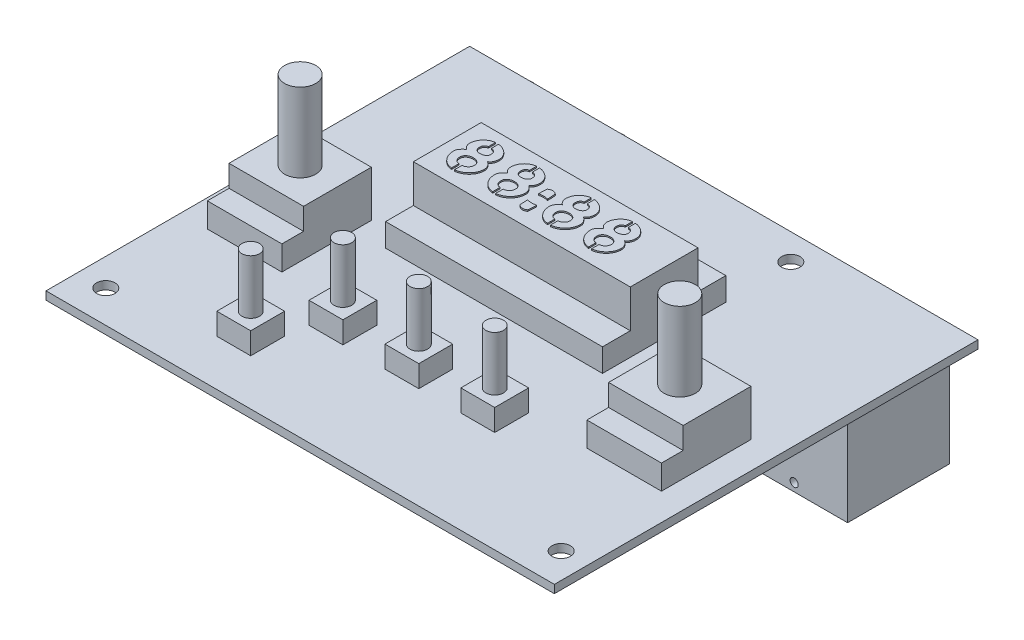
from build123d import *

# Parameters (mm, degrees)
SKETCH1_W                             = 95.25
SKETCH1_H                             = 79.375
BOSS_EXTRUDE1_DEPTH                   = 1.524
F_29_0_136_DIAMETER_HOLE1_D           = 3.4544
SKETCH4_W                             = 13.97
SKETCH4_H                             = 16.764
BOSS_EXTRUDE2_DEPTH                   = 4.572
SKETCH5_W                             = 13.97
SKETCH5_H                             = 12.7
BOSS_EXTRUDE3_DEPTH                   = 4.064
SKETCH8_W                             = 6.35
SKETCH8_H                             = 6.35
BOSS_EXTRUDE5_DEPTH                   = 4.064
BOSS_EXTRUDE5_2_DEPTH                 = 4.064
BOSS_EXTRUDE5_3_DEPTH                 = 4.064
BOSS_EXTRUDE5_4_DEPTH                 = 4.064
SKETCH9_R                             = 1.651
BOSS_EXTRUDE6_DEPTH                   = 10.16
BOSS_EXTRUDE6_2_DEPTH                 = 10.16
BOSS_EXTRUDE6_3_DEPTH                 = 10.16
BOSS_EXTRUDE6_4_DEPTH                 = 10.16
SKETCH10_R                            = 2.921
BOSS_EXTRUDE7_DEPTH                   = 14.732
BOSS_EXTRUDE7_2_DEPTH                 = 14.732
SKETCH11_W                            = 20.0152
SKETCH11_H                            = 21.336
BOSS_EXTRUDE8_DEPTH                   = 19.05
SKETCH12_R                            = 6.985
CUT_EXTRUDE1_DEPTH                    = 3.175
SKETCH14_W                            = 0.75565
SKETCH14_H                            = 79.375
F_53_0_0595_DIAMETER_HOLE1_AT_2_COUNT = 2
F_53_0_0595_DIAMETER_HOLE1_AT_2_PITCH = 17.4879
F_53_0_0595_DIAMETER_HOLE1_AT_3_COUNT = 2
F_53_0_0595_DIAMETER_HOLE1_AT_3_PITCH = 16.783370835
SKETCH15_W                            = 5.969
SKETCH15_H                            = 5.334
BOSS_EXTRUDE9_DEPTH                   = 13.97
SKETCH16_R                            = 2.54
SKETCH16_R_2                          = 1.778
BOSS_EXTRUDE10_DEPTH                  = 2.032
BOSS_EXTRUDE10_DRAFT                  = 9
BOSS_EXTRUDE10_PROFILE_2_DEPTH        = 2.032
BOSS_EXTRUDE10_PROFILE_2_DRAFT        = 9
SKETCH17_R                            = 1.778
CUT_EXTRUDE2_DEPTH                    = 12.7
SKETCH18_W                            = 40.64
SKETCH18_H                            = 23.114
BOSS_EXTRUDE11_DEPTH                  = 4.318
SKETCH19_W                            = 40.64
SKETCH19_H                            = 12.7
BOSS_EXTRUDE12_DEPTH                  = 7.112
SKETCH20_W                            = 33.02
SKETCH20_H                            = 2.410000006
BOSS_EXTRUDE13_DEPTH                  = 2.54
SKETCH21_W                            = 8.89
SKETCH21_H                            = 4.572
BOSS_EXTRUDE14_DEPTH                  = 4.826
SKETCH22_W                            = 8.89
SKETCH22_H                            = 2.032
BOSS_EXTRUDE15_DEPTH                  = 1.524
BOSS_EXTRUDE16_DEPTH                  = 0.254


with BuildPart() as part:
    # Sketch1 → Boss-Extrude1 (new body)
    with BuildSketch(Plane(origin=(0, 0, 0), x_dir=(1, 0, 0), z_dir=(0, 1, 0))):
        Rectangle(SKETCH1_W, SKETCH1_H)
    extrude(amount=BOSS_EXTRUDE1_DEPTH)

    # #29 (0.136) Diameter Hole1 (through all)
    with Locations(Plane(origin=(0, 1.524, 0), x_dir=(1, 0, 0), z_dir=(0, 1, 0))):
        with Locations((42.8498, -33.6423), (17.4498, 34.7853), (-25.8318, 22.2123), (-42.4688, -33.6423)):
            Hole(F_29_0_136_DIAMETER_HOLE1_D / 2)

    # Sketch4 → Boss-Extrude2 (add)
    with BuildSketch(Plane(origin=(0, 1.524, 0), x_dir=(1, 0, 0), z_dir=(0, 1, 0))):
        with Locations((35.56, -6.1595)):
            Rectangle(SKETCH4_W, SKETCH4_H)
        with Locations((-35.56, -6.1595)):
            Rectangle(SKETCH4_W, SKETCH4_H)
    extrude(amount=BOSS_EXTRUDE2_DEPTH)

    # Sketch5 → Boss-Extrude3 (add)
    with BuildSketch(Plane(origin=(0, 6.096, 0), x_dir=(1, 0, 0), z_dir=(0, 1, 0))):
        with Locations((-35.56, -4.1275)):
            Rectangle(SKETCH5_W, SKETCH5_H)
        with Locations((35.56, -4.1275)):
            Rectangle(SKETCH5_W, SKETCH5_H)
    extrude(amount=BOSS_EXTRUDE3_DEPTH)

    # Sketch15 → Boss-Extrude9 (add)
    with BuildSketch(Plane(origin=(0, 0, -39.6875), x_dir=(-1, 0, 0), z_dir=(0, 0, -1))):
        with Locations((37.9095, -2.667)):
            Rectangle(SKETCH15_W, SKETCH15_H)
        with Locations((20.8661, -2.667)):
            Rectangle(SKETCH15_W, SKETCH15_H)
    extrude(amount=-BOSS_EXTRUDE9_DEPTH)


with BuildPart() as body_2:
    # Sketch8 → Boss-Extrude5 (new body)
    with BuildSketch(Plane(origin=(0, 1.524, 0), x_dir=(1, 0, 0), z_dir=(0, 1, 0))):
        with Locations((-21.082, -27.8765)):
            Rectangle(SKETCH8_W, SKETCH8_H)
    extrude(amount=BOSS_EXTRUDE5_DEPTH)


with BuildPart() as body_3:
    # Sketch8 → Boss-Extrude5 2 (new body)
    with BuildSketch(Plane(origin=(0, 1.524, 0), x_dir=(1, 0, 0), z_dir=(0, 1, 0))):
        with Locations((14.224, -17.4625)):
            Rectangle(SKETCH8_W, SKETCH8_H)
    extrude(amount=BOSS_EXTRUDE5_2_DEPTH)


with BuildPart() as body_4:
    # Sketch8 → Boss-Extrude5 3 (new body)
    with BuildSketch(Plane(origin=(0, 1.524, 0), x_dir=(1, 0, 0), z_dir=(0, 1, 0))):
        with Locations((0, -17.4625)):
            Rectangle(SKETCH8_W, SKETCH8_H)
    extrude(amount=BOSS_EXTRUDE5_3_DEPTH)


with BuildPart() as body_5:
    # Sketch8 → Boss-Extrude5 4 (new body)
    with BuildSketch(Plane(origin=(0, 1.524, 0), x_dir=(1, 0, 0), z_dir=(0, 1, 0))):
        with Locations((-14.224, -17.4625)):
            Rectangle(SKETCH8_W, SKETCH8_H)
    extrude(amount=BOSS_EXTRUDE5_4_DEPTH)


with BuildPart() as body_6:
    # Sketch9 → Boss-Extrude6 (new body)
    with BuildSketch(Plane(origin=(0, 5.588, 0), x_dir=(1, 0, 0), z_dir=(0, 1, 0))):
        with Locations((-21.082, -27.8765)):
            Circle(SKETCH9_R)
    extrude(amount=BOSS_EXTRUDE6_DEPTH)


with BuildPart() as body_7:
    # Sketch9 → Boss-Extrude6 2 (new body)
    with BuildSketch(Plane(origin=(0, 5.588, 0), x_dir=(1, 0, 0), z_dir=(0, 1, 0))):
        with Locations((-14.224, -17.4625)):
            Circle(SKETCH9_R)
    extrude(amount=BOSS_EXTRUDE6_2_DEPTH)


with BuildPart() as body_8:
    # Sketch9 → Boss-Extrude6 3 (new body)
    with BuildSketch(Plane(origin=(0, 5.588, 0), x_dir=(1, 0, 0), z_dir=(0, 1, 0))):
        with Locations((0, -17.4625)):
            Circle(SKETCH9_R)
    extrude(amount=BOSS_EXTRUDE6_3_DEPTH)


with BuildPart() as body_9:
    # Sketch9 → Boss-Extrude6 4 (new body)
    with BuildSketch(Plane(origin=(0, 5.588, 0), x_dir=(1, 0, 0), z_dir=(0, 1, 0))):
        with Locations((14.224, -17.4625)):
            Circle(SKETCH9_R)
    extrude(amount=BOSS_EXTRUDE6_4_DEPTH)


with BuildPart() as body_10:
    # Sketch10 → Boss-Extrude7 (new body)
    with BuildSketch(Plane(origin=(0, 10.16, 0), x_dir=(1, 0, 0), z_dir=(0, 1, 0))):
        with Locations((-35.56, -4.1275)):
            Circle(SKETCH10_R)
    extrude(amount=BOSS_EXTRUDE7_DEPTH)


with BuildPart() as body_11:
    # Sketch10 → Boss-Extrude7 2 (new body)
    with BuildSketch(Plane(origin=(0, 10.16, 0), x_dir=(1, 0, 0), z_dir=(0, 1, 0))):
        with Locations((35.56, -4.1275)):
            Circle(SKETCH10_R)
    extrude(amount=BOSS_EXTRUDE7_2_DEPTH)


with BuildPart() as body_12:
    # Sketch11 → Boss-Extrude8 (new body)
    with BuildSketch(Plane(origin=(0, 0, -39.6875), x_dir=(-1, 0, 0), z_dir=(0, 0, -1))):
        with Locations((-32.2326, -10.668)):
            Rectangle(SKETCH11_W, SKETCH11_H)
    extrude(amount=-BOSS_EXTRUDE8_DEPTH)

    # Sketch12 → Cut-Extrude1 (cut)
    with BuildSketch(Plane(origin=(0, 0, -39.6875), x_dir=(-1, 0, 0), z_dir=(0, 0, -1))):
        with Locations((-32.2326, -10.541)):
            Circle(SKETCH12_R)
    extrude(amount=-CUT_EXTRUDE1_DEPTH, mode=Mode.SUBTRACT)

    # Sketch14 → #53 (0.0595) Diameter Hole1 (revolve, cut)
    with BuildSketch(Plane(origin=(40.97655, -5.492678114, -39.6875), x_dir=(0, 1, 0), z_dir=(1, 0, 0))):
        with Locations((0.377825, 39.6875)):
            Rectangle(SKETCH14_W, SKETCH14_H)
    f_53_0_0595_diameter_hole1 = revolve(axis=Axis((40.97655, -5.492678114, -46.0375), (0, 0, 1)), mode=Mode.SUBTRACT)

    # #53 (0.0595) Diameter Hole1 at 2: #53 (0.0595) Diameter Hole1 ×2
    with Locations(*[(-i * F_53_0_0595_DIAMETER_HOLE1_AT_2_PITCH, 0, 0) for i in range(1, F_53_0_0595_DIAMETER_HOLE1_AT_2_COUNT)]):
        add(f_53_0_0595_diameter_hole1, mode=Mode.SUBTRACT)

    # #53 (0.0595) Diameter Hole1 at 3: #53 (0.0595) Diameter Hole1 ×2
    with Locations(*[Vector(-0.5209889053752342, -0.8535634484184028, 0) * (i * F_53_0_0595_DIAMETER_HOLE1_AT_3_PITCH) for i in range(1, F_53_0_0595_DIAMETER_HOLE1_AT_3_COUNT)]):
        add(f_53_0_0595_diameter_hole1, mode=Mode.SUBTRACT)


with BuildPart() as boss_extrude10_tool:
    # Sketch16 → Boss-Extrude10 (with draft: the straight prism first)
    with BuildSketch(Plane(origin=(0, 0, -39.6875), x_dir=(-1, 0, 0), z_dir=(0, 0, -1))):
        with Locations((37.9095, -2.667)):
            Circle(SKETCH16_R)
        with Locations((37.9095, -2.667)):
            Circle(SKETCH16_R_2, mode=Mode.SUBTRACT)
    extrude(amount=BOSS_EXTRUDE10_DEPTH)
    # Boss-Extrude10: the draft: its side faces are tilted about the plane it starts from
    boss_extrude10_sides = [boss_extrude10_tool.faces().sort_by_distance(p)[0] for p in [
        (-35.3695, -2.667, -40.7035),
        (-36.1315, -2.667, -40.7035),
    ]]
    draft(boss_extrude10_sides, Plane(origin=(0, 0, -39.6875), x_dir=(-1, 0, 0), z_dir=(0, 0, -1)), BOSS_EXTRUDE10_DRAFT)


with BuildPart() as part_1:
    add(part.part)

    # Boss-Extrude10: add boss_extrude10_tool
    add(boss_extrude10_tool.part)


with BuildPart() as boss_extrude10_profile_2_tool:
    # Sketch16 → Boss-Extrude10 profile 2 (with draft: the straight prism first)
    with BuildSketch(Plane(origin=(0, 0, -39.6875), x_dir=(-1, 0, 0), z_dir=(0, 0, -1))):
        with Locations((20.8661, -2.667)):
            Circle(SKETCH16_R)
        with Locations((20.8661, -2.667)):
            Circle(SKETCH16_R_2, mode=Mode.SUBTRACT)
    extrude(amount=BOSS_EXTRUDE10_PROFILE_2_DEPTH)
    # Boss-Extrude10 profile 2: the draft: its side faces are tilted about the plane it starts from
    boss_extrude10_profile_2_sides = [boss_extrude10_profile_2_tool.faces().sort_by_distance(p)[0] for p in [
        (-18.3261, -2.667, -40.7035),
        (-19.0881, -2.667, -40.7035),
    ]]
    draft(boss_extrude10_profile_2_sides, Plane(origin=(0, 0, -39.6875), x_dir=(-1, 0, 0), z_dir=(0, 0, -1)), BOSS_EXTRUDE10_PROFILE_2_DRAFT)


with BuildPart() as part_2:
    add(part_1.part)

    # Boss-Extrude10 profile 2: add boss_extrude10_profile_2_tool
    add(boss_extrude10_profile_2_tool.part)

    # Sketch17 → Cut-Extrude2 (cut)
    with BuildSketch(Plane(origin=(0, 0, -39.6875), x_dir=(-1, 0, 0), z_dir=(0, 0, -1))):
        with Locations((37.9095, -2.667)):
            Circle(SKETCH17_R)
        with Locations((20.8661, -2.667)):
            Circle(SKETCH17_R)
    extrude(amount=-CUT_EXTRUDE2_DEPTH, mode=Mode.SUBTRACT)

    # Sketch18 → Boss-Extrude11 (add)
    with BuildSketch(Plane(origin=(0, 1.524, 0), x_dir=(1, 0, 0), z_dir=(0, 1, 0))):
        with Locations((-2.413, 10.6045)):
            Rectangle(SKETCH18_W, SKETCH18_H)
    extrude(amount=BOSS_EXTRUDE11_DEPTH)

    # Sketch19 → Boss-Extrude12 (add)
    with BuildSketch(Plane(origin=(0, 5.842, 0), x_dir=(1, 0, 0), z_dir=(0, 1, 0))):
        with Locations((-2.413, 10.6045)):
            Rectangle(SKETCH19_W, SKETCH19_H)
    extrude(amount=BOSS_EXTRUDE12_DEPTH)

    # Sketch20 → Boss-Extrude13 (add)
    with BuildSketch(Plane.XZ):
        with Locations((1.143, 34.672499997)):
            Rectangle(SKETCH20_W, SKETCH20_H)
    extrude(amount=BOSS_EXTRUDE13_DEPTH)

    # Sketch23 → Boss-Extrude16 (add)
    with BuildSketch(Plane(origin=(0, 12.954, 0), x_dir=(1, 0, 0), z_dir=(0, 1, 0))):
        with BuildLine():
            add(Edge.make_bspline(
                [(-14.59275285, 9.458275193), (-14.5958246, 9.535342211), (-14.601907288, 9.687950501), (-14.659415351, 9.91079508), (-14.748348029, 10.124090882), (-14.874410596, 10.32311803), (-15.020929076, 10.508695552), (-15.183091741, 10.678410699), (-15.35465531, 10.834358631), (-15.481467044, 10.921313393), (-15.544721308, 10.96468682)],
                knots=[0, 0, 0, 0, 0.995318931, 1.970932874, 2.958210881, 3.97438322, 5.007739601, 6.01292083, 7.008835956, 8, 8, 8, 8], degree=3))
            add(Edge.make_bspline(
                [(-15.544721308, 10.96468682), (-15.488142585, 10.998844815), (-15.375435373, 11.066888986), (-15.230415733, 11.202781299), (-15.103788521, 11.359908716), (-15.003931699, 11.541267209), (-14.922639254, 11.733648116), (-14.864933941, 11.932678891), (-14.82849111, 12.134423619), (-14.823604093, 12.270440932), (-14.821155539, 12.338590016)],
                knots=[0, 0, 0, 0, 0.973206171, 1.938667874, 2.915384234, 3.941165853, 4.983177624, 5.993087763, 6.994471904, 8, 8, 8, 8], degree=3))
            Line((-14.821155539, 12.338590016), (-14.821155539, 12.446688998))
            add(Edge.make_bspline(
                [(-14.821155539, 12.446688998), (-14.8239245, 12.525894752), (-14.829396746, 12.682427594), (-14.870279656, 12.912204597), (-14.938584682, 13.132604658), (-15.035852874, 13.341299205), (-15.152985917, 13.539346621), (-15.285787755, 13.727206328), (-15.436361413, 13.902411714), (-15.604371037, 14.063166722), (-15.783351949, 14.214594497), (-15.97747972, 14.347834251), (-16.18258586, 14.468101734), (-16.399438047, 14.568838363), (-16.621674946, 14.656403694), (-16.847259038, 14.725922398), (-17.074233765, 14.780051383), (-17.227575784, 14.799492513), (-17.303945071, 14.809174825)],
                knots=[0, 0, 0, 0, 1.017484137, 2.010834781, 2.988792481, 3.974674747, 4.962252912, 5.942460988, 6.927522522, 7.925774482, 8.927930235, 9.936881282, 10.947572307, 11.97991419, 13.006240961, 14.014943195, 15.01137748, 16, 16, 16, 16], degree=3))
            add(Edge.make_bspline(
                [(-17.303945071, 14.809174825), (-17.318183916, 14.807140704), (-17.346661604, 14.803072463), (-17.350729846, 14.774594774), (-17.352763966, 14.760355929)],
                knots=[0, 0, 0, 0, 1, 2, 2, 2, 2], degree=3))
            add(Edge.make_bspline(
                [(-17.352763966, 14.760355929), (-17.349422635, 14.655752491), (-17.342759609, 14.447160362), (-17.341291256, 14.238467072), (-17.340559243, 14.13442795)],
                knots=[0, 0, 0, 0, 1.002947133, 2, 2, 2, 2], degree=3))
            add(Edge.make_bspline(
                [(-17.340559243, 14.13442795), (-17.340559243, 14.032721918), (-17.340559243, 13.827566323), (-17.340559243, 13.622410727), (-17.340559243, 13.518961163)],
                knots=[0, 0, 0, 0, 0.991501416, 2, 2, 2, 2], degree=3))
            add(Edge.make_bspline(
                [(-17.340559243, 13.518961163), (-17.338353102, 13.505447516), (-17.333842295, 13.477816706), (-17.305977207, 13.473891348), (-17.291740347, 13.4718858)],
                knots=[0, 0, 0, 0, 0.978157849, 2, 2, 2, 2], degree=3))
            add(Edge.make_bspline(
                [(-17.291740347, 13.4718858), (-17.234917586, 13.463963561), (-17.121890648, 13.448205326), (-16.960820838, 13.3898859), (-16.80876771, 13.31111665), (-16.67032309, 13.20905014), (-16.550416625, 13.087064302), (-16.462657026, 12.942454003), (-16.410145833, 12.778563696), (-16.403984681, 12.663280477), (-16.400795508, 12.603606876)],
                knots=[0, 0, 0, 0, 1.005745738, 2.000542698, 2.99182103, 4.007011567, 5.011044689, 5.977873494, 6.953294593, 8, 8, 8, 8], degree=3))
            Line((-16.400795508, 12.603606876), (-16.400795508, 12.542583257))
            add(Edge.make_bspline(
                [(-16.400795508, 12.542583257), (-16.400250981, 12.533864088), (-16.399014446, 12.514064215), (-16.39619471, 12.483144513), (-16.389685936, 12.452121369), (-16.388933033, 12.431605497), (-16.388590784, 12.422279551)],
                knots=[0, 0, 0, 0, 0.866411576, 1.967485452, 3.076075278, 4, 4, 4, 4], degree=3))
            add(Edge.make_bspline(
                [(-16.388590784, 12.422279551), (-16.389969507, 12.389042581), (-16.392677943, 12.323750134), (-16.413034892, 12.228345167), (-16.443230373, 12.137076891), (-16.505376931, 12.026230039), (-16.603890919, 11.900325399), (-16.754483001, 11.778587549), (-16.927813235, 11.683112936), (-17.115240372, 11.610421598), (-17.311260988, 11.566253627), (-17.443225311, 11.559202103), (-17.507938312, 11.555744159)],
                knots=[0, 0, 0, 0, 0.637370974, 1.252084947, 1.865887407, 2.47480542, 3.682072335, 4.910335882, 6.163867148, 7.466846277, 8.757785619, 10, 10, 10, 10], degree=3))
            Line((-17.507938312, 11.555744159), (-17.701470361, 11.555744159))
            add(Edge.make_bspline(
                [(-17.701470361, 11.555744159), (-17.761056063, 11.559402073), (-17.880456769, 11.566731977), (-18.053629574, 11.616528895), (-18.212993498, 11.697684451), (-18.355032729, 11.80416109), (-18.474604521, 11.934204901), (-18.567233385, 12.082463334), (-18.631247306, 12.24711465), (-18.637887614, 12.363583391), (-18.641234096, 12.422279551)],
                knots=[0, 0, 0, 0, 1.013450506, 2.030801042, 3.03907653, 4.041760303, 5.035530285, 6.026047973, 7.005197428, 8, 8, 8, 8], degree=3))
            Line((-18.641234096, 12.422279551), (-18.641234096, 12.603606876))
            add(Edge.make_bspline(
                [(-18.641234096, 12.603606876), (-18.639645093, 12.654985975), (-18.636518045, 12.756096471), (-18.598974817, 12.902776884), (-18.543101979, 13.042358356), (-18.465586332, 13.172278948), (-18.367822656, 13.285938434), (-18.249319317, 13.373625191), (-18.11441684, 13.435265096), (-18.016492794, 13.45142759), (-17.966487222, 13.459681076)],
                knots=[0, 0, 0, 0, 1.030008905, 2.026985943, 3.022320288, 4.043687467, 5.053237222, 6.013141971, 6.985397581, 8, 8, 8, 8], degree=3))
            add(Edge.make_bspline(
                [(-17.966487222, 13.459681076), (-17.952250361, 13.461686624), (-17.924385274, 13.465611982), (-17.919874467, 13.493242792), (-17.917668326, 13.506756439)],
                knots=[0, 0, 0, 0, 1.021842151, 2, 2, 2, 2], degree=3))
            add(Edge.make_bspline(
                [(-17.917668326, 13.506756439), (-17.914169391, 13.561367895), (-17.907473605, 13.665875865), (-17.907293246, 13.770594907), (-17.907207134, 13.820592195)],
                knots=[0, 0, 0, 0, 1.045115631, 2, 2, 2, 2], degree=3))
            add(Edge.make_bspline(
                [(-17.907207134, 13.820592195), (-17.907207134, 13.872898154), (-17.907207134, 13.977510072), (-17.907207134, 14.082121991), (-17.907207134, 14.13442795)],
                knots=[0, 0, 0, 0, 1, 2, 2, 2, 2], degree=3))
            add(Edge.make_bspline(
                [(-17.907207134, 14.13442795), (-17.90671813, 14.18382915), (-17.905728516, 14.28380379), (-17.902495609, 14.436089916), (-17.895726318, 14.591183988), (-17.895243673, 14.695837408), (-17.895002411, 14.748151205)],
                knots=[0, 0, 0, 0, 0.965744349, 1.954404832, 2.977454803, 4, 4, 4, 4], degree=3))
            add(Edge.make_bspline(
                [(-17.895002411, 14.748151205), (-17.897007959, 14.762388066), (-17.900933317, 14.790253153), (-17.928564127, 14.79476396), (-17.942077774, 14.796970101)],
                knots=[0, 0, 0, 0, 1.021842151, 2, 2, 2, 2], degree=3))
            add(Edge.make_bspline(
                [(-17.942077774, 14.796970101), (-18.013798664, 14.789168238), (-18.156770398, 14.773615643), (-18.36701708, 14.723514977), (-18.571581628, 14.653245781), (-18.770089233, 14.564648838), (-18.958689867, 14.458051783), (-19.138681042, 14.339337912), (-19.305426231, 14.20424449), (-19.462648362, 14.05792206), (-19.608182956, 13.899856308), (-19.736933006, 13.726548572), (-19.856074737, 13.544812961), (-19.958504553, 13.351531066), (-20.043822774, 13.150748487), (-20.112503603, 12.945313474), (-20.160488286, 12.734392292), (-20.176313896, 12.591608644), (-20.184259894, 12.519917341)],
                knots=[0, 0, 0, 0, 1.001021632, 1.995482755, 2.99337639, 4.001271291, 5.009327732, 5.998667133, 6.991850302, 7.985394085, 8.979396645, 9.970446227, 10.980019879, 11.994516817, 13.003348289, 14.006319965, 14.998978368, 16, 16, 16, 16], degree=3))
            Line((-20.184259894, 12.519917341), (-20.196464618, 12.507712618))
            add(Edge.make_bspline(
                [(-20.196464618, 12.507712618), (-20.199810506, 12.490327159), (-20.206793455, 12.454043288), (-20.208026902, 12.417107872), (-20.208669341, 12.397870103)],
                knots=[0, 0, 0, 0, 0.958302254, 2, 2, 2, 2], degree=3))
            add(Edge.make_bspline(
                [(-20.208669341, 12.397870103), (-20.208669341, 12.381015961), (-20.208669341, 12.344982966), (-20.208669341, 12.308949972), (-20.208669341, 12.289771121)],
                knots=[0, 0, 0, 0, 0.935483871, 2, 2, 2, 2], degree=3))
            add(Edge.make_bspline(
                [(-20.208669341, 12.289771121), (-20.206528727, 12.22562717), (-20.202247588, 12.097341909), (-20.160954853, 11.907970565), (-20.100236811, 11.720729723), (-20.013377968, 11.540069363), (-19.906744148, 11.370999115), (-19.78285692, 11.218698933), (-19.644054069, 11.084336806), (-19.53797087, 11.012628083), (-19.485103572, 10.976891543)],
                knots=[0, 0, 0, 0, 0.985024158, 1.970007775, 2.967600018, 4.006910369, 5.043258017, 6.034223535, 7.020341646, 8, 8, 8, 8], degree=3))
            add(Edge.make_bspline(
                [(-19.485103572, 10.976891543), (-19.547925168, 10.93123187), (-19.674092358, 10.839531675), (-19.852519213, 10.686222048), (-20.017478542, 10.515016648), (-20.174955049, 10.335774348), (-20.308898622, 10.1409276), (-20.405427994, 9.928957023), (-20.462405878, 9.703606729), (-20.469902536, 9.548675718), (-20.473686202, 9.470479917)],
                knots=[0, 0, 0, 0, 0.993652422, 1.995592932, 3.005397526, 4.033954309, 5.046794601, 6.018720914, 7.000021345, 8, 8, 8, 8], degree=3))
            add(Edge.make_bspline(
                [(-20.473686202, 9.470479917), (-20.473158629, 9.450724983), (-20.472133763, 9.412348944), (-20.469702226, 9.355076607), (-20.459472462, 9.298380219), (-20.452746923, 9.260090172), (-20.449276754, 9.240333696)],
                knots=[0, 0, 0, 0, 1.023069621, 1.987420469, 2.961571409, 4, 4, 4, 4], degree=3))
            Line((-20.449276754, 9.240333696), (-20.449276754, 9.25253842))
            add(Edge.make_bspline(
                [(-20.449276754, 9.25253842), (-20.443514339, 9.170366071), (-20.43198951, 9.006021373), (-20.382331657, 8.763096319), (-20.314587415, 8.522578183), (-20.224329902, 8.286723099), (-20.11307083, 8.059718928), (-19.98447706, 7.844048278), (-19.842331886, 7.639171106), (-19.681006244, 7.449111589), (-19.505657309, 7.27337224), (-19.315967536, 7.113674148), (-19.113309577, 6.970293269), (-18.898086179, 6.844576307), (-18.670920154, 6.741537351), (-18.435259689, 6.662204406), (-18.19101118, 6.611130124), (-18.025401657, 6.597182584), (-17.942077774, 6.590165094)],
                knots=[0, 0, 0, 0, 0.991093162, 1.982186323, 2.979193569, 3.998313328, 5.018802209, 6.019928527, 7.019953186, 8.018310808, 9.018065988, 10.006560611, 11.000861602, 12.004480536, 13.003721054, 13.999745058, 14.993602505, 16, 16, 16, 16], degree=3))
            add(Edge.make_bspline(
                [(-17.942077774, 6.590165094), (-17.928565401, 6.592344509), (-17.901540655, 6.596703339), (-17.897181826, 6.623728085), (-17.895002411, 6.637240458)],
                knots=[0, 0, 0, 0, 1, 2, 2, 2, 2], degree=3))
            Line((-17.895002411, 6.637240458), (-17.895002411, 7.277116692))
            add(Edge.make_bspline(
                [(-17.895002411, 7.277116692), (-17.895211762, 7.332336936), (-17.895621747, 7.440478166), (-17.902628482, 7.601961098), (-17.905782165, 7.763549467), (-17.90672712, 7.87224127), (-17.907207134, 7.927454119)],
                knots=[0, 0, 0, 0, 1.018600088, 1.99478774, 2.981399912, 4, 4, 4, 4], degree=3))
            add(Edge.make_bspline(
                [(-17.907207134, 7.927454119), (-17.909212683, 7.941690979), (-17.913138041, 7.969556066), (-17.940768851, 7.974066874), (-17.954282498, 7.976273014)],
                knots=[0, 0, 0, 0, 1.021842151, 2, 2, 2, 2], degree=3))
            add(Edge.make_bspline(
                [(-17.954282498, 7.976273014), (-18.020564007, 7.980444737), (-18.150273562, 7.988608586), (-18.332626027, 8.058503593), (-18.489278479, 8.166459039), (-18.628420501, 8.295935569), (-18.738732643, 8.452014474), (-18.821082747, 8.624491382), (-18.870689668, 8.809911103), (-18.87813759, 8.93668198), (-18.881841508, 8.999726284)],
                knots=[0, 0, 0, 0, 1.03923749, 2.033735126, 3.022001828, 4.017254619, 5.006070206, 6.007343738, 7.009034032, 8, 8, 8, 8], degree=3))
            Line((-18.881841508, 8.999726284), (-18.881841508, 9.072954627))
            add(Edge.make_bspline(
                [(-18.881841508, 9.072954627), (-18.882041678, 9.081150518), (-18.882432121, 9.097137049), (-18.889619503, 9.120353269), (-18.89254183, 9.14436645), (-18.89354603, 9.160708656), (-18.894046232, 9.168848885)],
                knots=[0, 0, 0, 0, 1.010575764, 1.971182807, 2.989424236, 4, 4, 4, 4], degree=3))
            add(Edge.make_bspline(
                [(-18.894046232, 9.168848885), (-18.892849636, 9.208488542), (-18.890509184, 9.286020746), (-18.867780736, 9.399248091), (-18.836015675, 9.507689361), (-18.771486716, 9.642858438), (-18.665574392, 9.798935747), (-18.501397626, 9.957836715), (-18.309398837, 10.087278791), (-18.095671035, 10.179792093), (-17.871195813, 10.242626837), (-17.716985749, 10.249776958), (-17.640446742, 10.253325774)],
                knots=[0, 0, 0, 0, 0.64801719, 1.26747319, 1.884367176, 2.492990243, 3.712019454, 4.949835234, 6.211045677, 7.480267519, 8.749382399, 10, 10, 10, 10], degree=3))
            Line((-17.640446742, 10.253325774), (-17.556757207, 10.253325774))
            add(Edge.make_bspline(
                [(-17.556757207, 10.253325774), (-17.5451268, 10.253779885), (-17.522977751, 10.254644698), (-17.490340558, 10.257967399), (-17.458221098, 10.265021943), (-17.435917997, 10.265355813), (-17.424248777, 10.265530498)],
                knots=[0, 0, 0, 0, 1.048304645, 1.996400496, 2.951695355, 4, 4, 4, 4], degree=3))
            add(Edge.make_bspline(
                [(-17.424248777, 10.265530498), (-17.347723276, 10.261905963), (-17.192414077, 10.254549937), (-16.965143277, 10.191772377), (-16.7491203, 10.100271227), (-16.554512404, 9.974930271), (-16.386289555, 9.81998795), (-16.283129606, 9.659668022), (-16.21608135, 9.52200222), (-16.184582859, 9.409071656), (-16.161995691, 9.291216212), (-16.159645421, 9.210228897), (-16.158444563, 9.168848885)],
                knots=[0, 0, 0, 0, 1.234039438, 2.504494217, 3.782693636, 5.011688637, 6.226839427, 7.445285228, 8.066822692, 8.693513545, 9.332458123, 10, 10, 10, 10], degree=3))
            add(Edge.make_bspline(
                [(-16.158444563, 9.168848885), (-16.158732738, 9.16009277), (-16.159332964, 9.141855086), (-16.166019388, 9.114983933), (-16.169095375, 9.087549383), (-16.170143553, 9.069472026), (-16.170649287, 9.060749903)],
                knots=[0, 0, 0, 0, 0.962594109, 2.00494014, 3.037405891, 4, 4, 4, 4], degree=3))
            add(Edge.make_bspline(
                [(-16.170649287, 9.060749903), (-16.176456254, 8.988764192), (-16.187835496, 8.847702111), (-16.254792789, 8.645993486), (-16.361861683, 8.463248504), (-16.505050683, 8.303042663), (-16.672761259, 8.167880265), (-16.857863247, 8.064162756), (-17.056702028, 7.990527824), (-17.196405476, 7.972978055), (-17.2673309, 7.964068291)],
                knots=[0, 0, 0, 0, 1.019336045, 1.997475105, 2.978067161, 3.998033706, 5.021973388, 6.012760731, 6.991107325, 8, 8, 8, 8], degree=3))
            add(Edge.make_bspline(
                [(-17.2673309, 7.964068291), (-17.281569744, 7.96203417), (-17.310047433, 7.957965929), (-17.314115674, 7.92948824), (-17.316149795, 7.915249395)],
                knots=[0, 0, 0, 0, 1, 2, 2, 2, 2], degree=3))
            add(Edge.make_bspline(
                [(-17.316149795, 7.915249395), (-17.316368341, 7.860029425), (-17.316798634, 7.751307814), (-17.323707649, 7.589821897), (-17.326956213, 7.428236126), (-17.32788181, 7.320124994), (-17.328354519, 7.264911969)],
                knots=[0, 0, 0, 0, 1.018600902, 2.005505097, 2.981399098, 4, 4, 4, 4], degree=3))
            add(Edge.make_bspline(
                [(-17.328354519, 7.264911969), (-17.328354519, 7.211443655), (-17.328354519, 7.102763495), (-17.328354519, 6.994083335), (-17.328354519, 6.938871489)],
                knots=[0, 0, 0, 0, 0.983957219, 2, 2, 2, 2], degree=3))
            add(Edge.make_bspline(
                [(-17.328354519, 6.938871489), (-17.329121302, 6.885969599), (-17.330689489, 6.777777375), (-17.33722126, 6.669770272), (-17.340559243, 6.614574542)],
                knots=[0, 0, 0, 0, 0.977924061, 2, 2, 2, 2], degree=3))
            add(Edge.make_bspline(
                [(-17.340559243, 6.614574542), (-17.338525122, 6.600335697), (-17.334456881, 6.571858009), (-17.305979192, 6.567789767), (-17.291740347, 6.565755647)],
                knots=[0, 0, 0, 0, 1, 2, 2, 2, 2], degree=3))
            add(Edge.make_bspline(
                [(-17.291740347, 6.565755647), (-17.2077476, 6.575615799), (-17.039397296, 6.595378929), (-16.791948824, 6.657003491), (-16.547398429, 6.737250696), (-16.308594488, 6.840049108), (-16.077243736, 6.961123899), (-15.859101495, 7.101354724), (-15.653652646, 7.256718146), (-15.463752378, 7.430247956), (-15.287741848, 7.61712513), (-15.130738316, 7.819576364), (-14.988362926, 8.031829033), (-14.866965164, 8.257591691), (-14.762366827, 8.492734002), (-14.685220421, 8.738566631), (-14.628798007, 8.99231323), (-14.612969153, 9.165089725), (-14.604957574, 9.25253842)],
                knots=[0, 0, 0, 0, 0.984994069, 1.974266293, 2.96624927, 3.983093936, 5.001382152, 6.006877751, 7.002855415, 8.000490893, 9.002327637, 9.991715857, 10.983883914, 11.978270245, 12.976457716, 13.979233314, 14.977213824, 16, 16, 16, 16], degree=3))
            Line((-14.604957574, 9.25253842), (-14.604957574, 9.240333696))
            add(Edge.make_bspline(
                [(-14.604957574, 9.240333696), (-14.601626723, 9.259466271), (-14.59529535, 9.295833993), (-14.59357035, 9.332703337), (-14.59275285, 9.350176211)],
                knots=[0, 0, 0, 0, 1.052173348, 2, 2, 2, 2], degree=3))
            add(Edge.make_bspline(
                [(-14.59275285, 9.350176211), (-14.59275285, 9.367030353), (-14.59275285, 9.403063347), (-14.59275285, 9.439096341), (-14.59275285, 9.458275193)],
                knots=[0, 0, 0, 0, 0.935483871, 2, 2, 2, 2], degree=3))
        make_face()
        with BuildLine():
            add(Edge.make_bspline(
                [(-6.893315648, 9.458275193), (-6.896387399, 9.535342211), (-6.902470086, 9.687950501), (-6.959978149, 9.91079508), (-7.048910828, 10.124090882), (-7.174973394, 10.32311803), (-7.321491875, 10.508695552), (-7.48365454, 10.678410699), (-7.655218108, 10.834358631), (-7.782029842, 10.921313393), (-7.845284107, 10.96468682)],
                knots=[0, 0, 0, 0, 0.995318931, 1.970932874, 2.958210881, 3.97438322, 5.007739601, 6.01292083, 7.008835956, 8, 8, 8, 8], degree=3))
            add(Edge.make_bspline(
                [(-7.845284107, 10.96468682), (-7.788705383, 10.998844815), (-7.675998171, 11.066888986), (-7.530978532, 11.202781299), (-7.404351319, 11.359908716), (-7.304494498, 11.541267209), (-7.223202053, 11.733648116), (-7.16549674, 11.932678891), (-7.129053909, 12.134423619), (-7.124166891, 12.270440932), (-7.121718337, 12.338590016)],
                knots=[0, 0, 0, 0, 0.973206171, 1.938667874, 2.915384234, 3.941165853, 4.983177624, 5.993087763, 6.994471904, 8, 8, 8, 8], degree=3))
            Line((-7.121718337, 12.338590016), (-7.121718337, 12.446688998))
            add(Edge.make_bspline(
                [(-7.121718337, 12.446688998), (-7.124487298, 12.525894752), (-7.129959544, 12.682427594), (-7.170842454, 12.912204597), (-7.23914748, 13.132604658), (-7.336415673, 13.341299205), (-7.453548716, 13.539346621), (-7.586350553, 13.727206328), (-7.736924212, 13.902411714), (-7.904933835, 14.063166722), (-8.083914747, 14.214594497), (-8.278042518, 14.347834251), (-8.483148658, 14.468101734), (-8.700000845, 14.568838363), (-8.922237745, 14.656403694), (-9.147821837, 14.725922398), (-9.374796563, 14.780051383), (-9.528138582, 14.799492513), (-9.604507869, 14.809174825)],
                knots=[0, 0, 0, 0, 1.017484137, 2.010834781, 2.988792481, 3.974674747, 4.962252912, 5.942460988, 6.927522522, 7.925774482, 8.927930235, 9.936881282, 10.947572307, 11.97991419, 13.006240961, 14.014943195, 15.01137748, 16, 16, 16, 16], degree=3))
            add(Edge.make_bspline(
                [(-9.604507869, 14.809174825), (-9.618746714, 14.807140704), (-9.647224403, 14.803072463), (-9.651292644, 14.774594774), (-9.653326765, 14.760355929)],
                knots=[0, 0, 0, 0, 1, 2, 2, 2, 2], degree=3))
            add(Edge.make_bspline(
                [(-9.653326765, 14.760355929), (-9.649985433, 14.655752491), (-9.643322408, 14.447160362), (-9.641854054, 14.238467072), (-9.641122041, 14.13442795)],
                knots=[0, 0, 0, 0, 1.002947133, 2, 2, 2, 2], degree=3))
            add(Edge.make_bspline(
                [(-9.641122041, 14.13442795), (-9.641122041, 14.032721918), (-9.641122041, 13.827566323), (-9.641122041, 13.622410727), (-9.641122041, 13.518961163)],
                knots=[0, 0, 0, 0, 0.991501416, 2, 2, 2, 2], degree=3))
            add(Edge.make_bspline(
                [(-9.641122041, 13.518961163), (-9.6389159, 13.505447516), (-9.634405093, 13.477816706), (-9.606540006, 13.473891348), (-9.592303146, 13.4718858)],
                knots=[0, 0, 0, 0, 0.978157849, 2, 2, 2, 2], degree=3))
            add(Edge.make_bspline(
                [(-9.592303146, 13.4718858), (-9.535480384, 13.463963561), (-9.422453446, 13.448205326), (-9.261383636, 13.3898859), (-9.109330509, 13.31111665), (-8.970885888, 13.20905014), (-8.850979424, 13.087064302), (-8.763219824, 12.942454003), (-8.710708631, 12.778563696), (-8.704547479, 12.663280477), (-8.701358306, 12.603606876)],
                knots=[0, 0, 0, 0, 1.005745738, 2.000542698, 2.99182103, 4.007011567, 5.011044689, 5.977873494, 6.953294593, 8, 8, 8, 8], degree=3))
            Line((-8.701358306, 12.603606876), (-8.701358306, 12.542583257))
            add(Edge.make_bspline(
                [(-8.701358306, 12.542583257), (-8.70081378, 12.533864088), (-8.699577245, 12.514064215), (-8.696757509, 12.483144513), (-8.690248735, 12.452121369), (-8.689495831, 12.431605497), (-8.689153582, 12.422279551)],
                knots=[0, 0, 0, 0, 0.866411576, 1.967485452, 3.076075278, 4, 4, 4, 4], degree=3))
            add(Edge.make_bspline(
                [(-8.689153582, 12.422279551), (-8.690532306, 12.389042581), (-8.693240742, 12.323750134), (-8.713597691, 12.228345167), (-8.743793171, 12.137076891), (-8.805939729, 12.026230039), (-8.904453717, 11.900325399), (-9.0550458, 11.778587549), (-9.228376033, 11.683112936), (-9.41580317, 11.610421598), (-9.611823786, 11.566253627), (-9.743788109, 11.559202103), (-9.80850111, 11.555744159)],
                knots=[0, 0, 0, 0, 0.637370974, 1.252084947, 1.865887407, 2.47480542, 3.682072335, 4.910335882, 6.163867148, 7.466846277, 8.757785619, 10, 10, 10, 10], degree=3))
            Line((-9.80850111, 11.555744159), (-10.00203316, 11.555744159))
            add(Edge.make_bspline(
                [(-10.00203316, 11.555744159), (-10.061618861, 11.559402073), (-10.181019567, 11.566731977), (-10.354192372, 11.616528895), (-10.513556296, 11.697684451), (-10.655595527, 11.80416109), (-10.77516732, 11.934204901), (-10.867796183, 12.082463334), (-10.931810105, 12.24711465), (-10.938450412, 12.363583391), (-10.941796894, 12.422279551)],
                knots=[0, 0, 0, 0, 1.013450506, 2.030801042, 3.03907653, 4.041760303, 5.035530285, 6.026047973, 7.005197428, 8, 8, 8, 8], degree=3))
            Line((-10.941796894, 12.422279551), (-10.941796894, 12.603606876))
            add(Edge.make_bspline(
                [(-10.941796894, 12.603606876), (-10.940207891, 12.654985975), (-10.937080844, 12.756096471), (-10.899537615, 12.902776884), (-10.843664777, 13.042358356), (-10.76614913, 13.172278948), (-10.668385454, 13.285938434), (-10.549882115, 13.373625191), (-10.414979639, 13.435265096), (-10.317055593, 13.45142759), (-10.26705002, 13.459681076)],
                knots=[0, 0, 0, 0, 1.030008905, 2.026985943, 3.022320288, 4.043687467, 5.053237222, 6.013141971, 6.985397581, 8, 8, 8, 8], degree=3))
            add(Edge.make_bspline(
                [(-10.26705002, 13.459681076), (-10.25281316, 13.461686624), (-10.224948073, 13.465611982), (-10.220437265, 13.493242792), (-10.218231125, 13.506756439)],
                knots=[0, 0, 0, 0, 1.021842151, 2, 2, 2, 2], degree=3))
            add(Edge.make_bspline(
                [(-10.218231125, 13.506756439), (-10.214732189, 13.561367895), (-10.208036404, 13.665875865), (-10.207856044, 13.770594907), (-10.207769933, 13.820592195)],
                knots=[0, 0, 0, 0, 1.045115631, 2, 2, 2, 2], degree=3))
            add(Edge.make_bspline(
                [(-10.207769933, 13.820592195), (-10.207769933, 13.872898154), (-10.207769933, 13.977510072), (-10.207769933, 14.082121991), (-10.207769933, 14.13442795)],
                knots=[0, 0, 0, 0, 1, 2, 2, 2, 2], degree=3))
            add(Edge.make_bspline(
                [(-10.207769933, 14.13442795), (-10.207280928, 14.18382915), (-10.206291314, 14.28380379), (-10.203058407, 14.436089916), (-10.196289116, 14.591183988), (-10.195806472, 14.695837408), (-10.195565209, 14.748151205)],
                knots=[0, 0, 0, 0, 0.965744349, 1.954404832, 2.977454803, 4, 4, 4, 4], degree=3))
            add(Edge.make_bspline(
                [(-10.195565209, 14.748151205), (-10.197570757, 14.762388066), (-10.201496115, 14.790253153), (-10.229126925, 14.79476396), (-10.242640572, 14.796970101)],
                knots=[0, 0, 0, 0, 1.021842151, 2, 2, 2, 2], degree=3))
            add(Edge.make_bspline(
                [(-10.242640572, 14.796970101), (-10.314361462, 14.789168238), (-10.457333196, 14.773615643), (-10.667579879, 14.723514977), (-10.872144426, 14.653245781), (-11.070652031, 14.564648838), (-11.259252665, 14.458051783), (-11.43924384, 14.339337912), (-11.60598903, 14.20424449), (-11.76321116, 14.05792206), (-11.908745755, 13.899856308), (-12.037495804, 13.726548572), (-12.156637535, 13.544812961), (-12.259067351, 13.351531066), (-12.344385572, 13.150748487), (-12.413066401, 12.945313474), (-12.461051084, 12.734392292), (-12.476876694, 12.591608644), (-12.484822692, 12.519917341)],
                knots=[0, 0, 0, 0, 1.001021632, 1.995482755, 2.99337639, 4.001271291, 5.009327732, 5.998667133, 6.991850302, 7.985394085, 8.979396645, 9.970446227, 10.980019879, 11.994516817, 13.003348289, 14.006319965, 14.998978368, 16, 16, 16, 16], degree=3))
            Line((-12.484822692, 12.519917341), (-12.497027416, 12.507712618))
            add(Edge.make_bspline(
                [(-12.497027416, 12.507712618), (-12.500373304, 12.490327159), (-12.507356253, 12.454043288), (-12.5085897, 12.417107872), (-12.50923214, 12.397870103)],
                knots=[0, 0, 0, 0, 0.958302254, 2, 2, 2, 2], degree=3))
            add(Edge.make_bspline(
                [(-12.50923214, 12.397870103), (-12.50923214, 12.381015961), (-12.50923214, 12.344982966), (-12.50923214, 12.308949972), (-12.50923214, 12.289771121)],
                knots=[0, 0, 0, 0, 0.935483871, 2, 2, 2, 2], degree=3))
            add(Edge.make_bspline(
                [(-12.50923214, 12.289771121), (-12.507091526, 12.22562717), (-12.502810386, 12.097341909), (-12.461517652, 11.907970565), (-12.400799609, 11.720729723), (-12.313940767, 11.540069363), (-12.207306946, 11.370999115), (-12.083419719, 11.218698933), (-11.944616867, 11.084336806), (-11.838533669, 11.012628083), (-11.78566637, 10.976891543)],
                knots=[0, 0, 0, 0, 0.985024158, 1.970007775, 2.967600018, 4.006910369, 5.043258017, 6.034223535, 7.020341646, 8, 8, 8, 8], degree=3))
            add(Edge.make_bspline(
                [(-11.78566637, 10.976891543), (-11.848487967, 10.93123187), (-11.974655157, 10.839531675), (-12.153082011, 10.686222048), (-12.31804134, 10.515016648), (-12.475517848, 10.335774348), (-12.60946142, 10.1409276), (-12.705990792, 9.928957023), (-12.762968676, 9.703606729), (-12.770465334, 9.548675718), (-12.774249, 9.470479917)],
                knots=[0, 0, 0, 0, 0.993652422, 1.995592932, 3.005397526, 4.033954309, 5.046794601, 6.018720914, 7.000021345, 8, 8, 8, 8], degree=3))
            add(Edge.make_bspline(
                [(-12.774249, 9.470479917), (-12.773721427, 9.450724983), (-12.772696562, 9.412348944), (-12.770265024, 9.355076607), (-12.76003526, 9.298380219), (-12.753309721, 9.260090172), (-12.749839552, 9.240333696)],
                knots=[0, 0, 0, 0, 1.023069621, 1.987420469, 2.961571409, 4, 4, 4, 4], degree=3))
            Line((-12.749839552, 9.240333696), (-12.749839552, 9.25253842))
            add(Edge.make_bspline(
                [(-12.749839552, 9.25253842), (-12.744077138, 9.170366071), (-12.732552309, 9.006021373), (-12.682894456, 8.763096319), (-12.615150213, 8.522578183), (-12.5248927, 8.286723099), (-12.413633629, 8.059718928), (-12.285039858, 7.844048278), (-12.142894685, 7.639171106), (-11.981569043, 7.449111589), (-11.806220108, 7.27337224), (-11.616530334, 7.113674148), (-11.413872375, 6.970293269), (-11.198648977, 6.844576307), (-10.971482952, 6.741537351), (-10.735822487, 6.662204406), (-10.491573978, 6.611130124), (-10.325964455, 6.597182584), (-10.242640572, 6.590165094)],
                knots=[0, 0, 0, 0, 0.991093162, 1.982186323, 2.979193569, 3.998313328, 5.018802209, 6.019928527, 7.019953186, 8.018310808, 9.018065988, 10.006560611, 11.000861602, 12.004480536, 13.003721054, 13.999745058, 14.993602505, 16, 16, 16, 16], degree=3))
            add(Edge.make_bspline(
                [(-10.242640572, 6.590165094), (-10.229128199, 6.592344509), (-10.202103454, 6.596703339), (-10.197744624, 6.623728085), (-10.195565209, 6.637240458)],
                knots=[0, 0, 0, 0, 1, 2, 2, 2, 2], degree=3))
            Line((-10.195565209, 6.637240458), (-10.195565209, 7.277116692))
            add(Edge.make_bspline(
                [(-10.195565209, 7.277116692), (-10.19577456, 7.332336936), (-10.196184545, 7.440478166), (-10.20319128, 7.601961098), (-10.206344964, 7.763549467), (-10.207289918, 7.87224127), (-10.207769933, 7.927454119)],
                knots=[0, 0, 0, 0, 1.018600088, 1.99478774, 2.981399912, 4, 4, 4, 4], degree=3))
            add(Edge.make_bspline(
                [(-10.207769933, 7.927454119), (-10.209775481, 7.941690979), (-10.213700839, 7.969556066), (-10.241331649, 7.974066874), (-10.254845296, 7.976273014)],
                knots=[0, 0, 0, 0, 1.021842151, 2, 2, 2, 2], degree=3))
            add(Edge.make_bspline(
                [(-10.254845296, 7.976273014), (-10.321126805, 7.980444737), (-10.450836361, 7.988608586), (-10.633188826, 8.058503593), (-10.789841277, 8.166459039), (-10.928983299, 8.295935569), (-11.039295442, 8.452014474), (-11.121645545, 8.624491382), (-11.171252466, 8.809911103), (-11.178700388, 8.93668198), (-11.182404307, 8.999726284)],
                knots=[0, 0, 0, 0, 1.03923749, 2.033735126, 3.022001828, 4.017254619, 5.006070206, 6.007343738, 7.009034032, 8, 8, 8, 8], degree=3))
            Line((-11.182404307, 8.999726284), (-11.182404307, 9.072954627))
            add(Edge.make_bspline(
                [(-11.182404307, 9.072954627), (-11.182604477, 9.081150518), (-11.182994919, 9.097137049), (-11.190182301, 9.120353269), (-11.193104629, 9.14436645), (-11.194108828, 9.160708656), (-11.194609031, 9.168848885)],
                knots=[0, 0, 0, 0, 1.010575764, 1.971182807, 2.989424236, 4, 4, 4, 4], degree=3))
            add(Edge.make_bspline(
                [(-11.194609031, 9.168848885), (-11.193412435, 9.208488542), (-11.191071982, 9.286020746), (-11.168343534, 9.399248091), (-11.136578473, 9.507689361), (-11.072049515, 9.642858438), (-10.96613719, 9.798935747), (-10.801960424, 9.957836715), (-10.609961636, 10.087278791), (-10.396233833, 10.179792093), (-10.171758611, 10.242626837), (-10.017548547, 10.249776958), (-9.941009541, 10.253325774)],
                knots=[0, 0, 0, 0, 0.64801719, 1.26747319, 1.884367176, 2.492990243, 3.712019454, 4.949835234, 6.211045677, 7.480267519, 8.749382399, 10, 10, 10, 10], degree=3))
            Line((-9.941009541, 10.253325774), (-9.857320006, 10.253325774))
            add(Edge.make_bspline(
                [(-9.857320006, 10.253325774), (-9.845689599, 10.253779885), (-9.82354055, 10.254644698), (-9.790903356, 10.257967399), (-9.758783896, 10.265021943), (-9.736480796, 10.265355813), (-9.724811576, 10.265530498)],
                knots=[0, 0, 0, 0, 1.048304645, 1.996400496, 2.951695355, 4, 4, 4, 4], degree=3))
            add(Edge.make_bspline(
                [(-9.724811576, 10.265530498), (-9.648286074, 10.261905963), (-9.492976876, 10.254549937), (-9.265706075, 10.191772377), (-9.049683098, 10.100271227), (-8.855075202, 9.974930271), (-8.686852353, 9.81998795), (-8.583692405, 9.659668022), (-8.516644148, 9.52200222), (-8.485145657, 9.409071656), (-8.462558489, 9.291216212), (-8.460208219, 9.210228897), (-8.459007362, 9.168848885)],
                knots=[0, 0, 0, 0, 1.234039438, 2.504494217, 3.782693636, 5.011688637, 6.226839427, 7.445285228, 8.066822692, 8.693513545, 9.332458123, 10, 10, 10, 10], degree=3))
            add(Edge.make_bspline(
                [(-8.459007362, 9.168848885), (-8.459295537, 9.16009277), (-8.459895762, 9.141855086), (-8.466582186, 9.114983933), (-8.469658173, 9.087549383), (-8.470706351, 9.069472026), (-8.471212086, 9.060749903)],
                knots=[0, 0, 0, 0, 0.962594109, 2.00494014, 3.037405891, 4, 4, 4, 4], degree=3))
            add(Edge.make_bspline(
                [(-8.471212086, 9.060749903), (-8.477019052, 8.988764192), (-8.488398294, 8.847702111), (-8.555355587, 8.645993486), (-8.662424481, 8.463248504), (-8.805613481, 8.303042663), (-8.973324057, 8.167880265), (-9.158426045, 8.064162756), (-9.357264826, 7.990527824), (-9.496968275, 7.972978055), (-9.567893698, 7.964068291)],
                knots=[0, 0, 0, 0, 1.019336045, 1.997475105, 2.978067161, 3.998033706, 5.021973388, 6.012760731, 6.991107325, 8, 8, 8, 8], degree=3))
            add(Edge.make_bspline(
                [(-9.567893698, 7.964068291), (-9.582132542, 7.96203417), (-9.610610231, 7.957965929), (-9.614678473, 7.92948824), (-9.616712593, 7.915249395)],
                knots=[0, 0, 0, 0, 1, 2, 2, 2, 2], degree=3))
            add(Edge.make_bspline(
                [(-9.616712593, 7.915249395), (-9.61693114, 7.860029425), (-9.617361432, 7.751307814), (-9.624270447, 7.589821897), (-9.627519011, 7.428236126), (-9.628444609, 7.320124994), (-9.628917317, 7.264911969)],
                knots=[0, 0, 0, 0, 1.018600902, 2.005505097, 2.981399098, 4, 4, 4, 4], degree=3))
            add(Edge.make_bspline(
                [(-9.628917317, 7.264911969), (-9.628917317, 7.211443655), (-9.628917317, 7.102763495), (-9.628917317, 6.994083335), (-9.628917317, 6.938871489)],
                knots=[0, 0, 0, 0, 0.983957219, 2, 2, 2, 2], degree=3))
            add(Edge.make_bspline(
                [(-9.628917317, 6.938871489), (-9.629684101, 6.885969599), (-9.631252287, 6.777777375), (-9.637784058, 6.669770272), (-9.641122041, 6.614574542)],
                knots=[0, 0, 0, 0, 0.977924061, 2, 2, 2, 2], degree=3))
            add(Edge.make_bspline(
                [(-9.641122041, 6.614574542), (-9.63908792, 6.600335697), (-9.635019679, 6.571858009), (-9.60654199, 6.567789767), (-9.592303146, 6.565755647)],
                knots=[0, 0, 0, 0, 1, 2, 2, 2, 2], degree=3))
            add(Edge.make_bspline(
                [(-9.592303146, 6.565755647), (-9.508310398, 6.575615799), (-9.339960094, 6.595378929), (-9.092511623, 6.657003491), (-8.847961228, 6.737250696), (-8.609157287, 6.840049108), (-8.377806535, 6.961123899), (-8.159664293, 7.101354724), (-7.954215444, 7.256718146), (-7.764315176, 7.430247956), (-7.588304646, 7.61712513), (-7.431301114, 7.819576364), (-7.288925724, 8.031829033), (-7.167527963, 8.257591691), (-7.062929625, 8.492734002), (-6.985783219, 8.738566631), (-6.929360806, 8.99231323), (-6.913531952, 9.165089725), (-6.905520372, 9.25253842)],
                knots=[0, 0, 0, 0, 0.984994069, 1.974266293, 2.96624927, 3.983093936, 5.001382152, 6.006877751, 7.002855415, 8.000490893, 9.002327637, 9.991715857, 10.983883914, 11.978270245, 12.976457716, 13.979233314, 14.977213824, 16, 16, 16, 16], degree=3))
            Line((-6.905520372, 9.25253842), (-6.905520372, 9.240333696))
            add(Edge.make_bspline(
                [(-6.905520372, 9.240333696), (-6.902189521, 9.259466271), (-6.895858148, 9.295833993), (-6.894133149, 9.332703337), (-6.893315648, 9.350176211)],
                knots=[0, 0, 0, 0, 1.052173348, 2, 2, 2, 2], degree=3))
            add(Edge.make_bspline(
                [(-6.893315648, 9.350176211), (-6.893315648, 9.367030353), (-6.893315648, 9.403063347), (-6.893315648, 9.439096341), (-6.893315648, 9.458275193)],
                knots=[0, 0, 0, 0, 0.935483871, 2, 2, 2, 2], degree=3))
        make_face()
        with BuildLine():
            add(Edge.make_bspline(
                [(-3.845621756, 10.579366253), (-3.846420552, 10.62819746), (-3.848028823, 10.726512588), (-3.857098073, 10.874168275), (-3.870564638, 11.021554763), (-3.877197148, 11.119845842), (-3.880492395, 11.168680061)],
                knots=[0, 0, 0, 0, 0.992390068, 1.998045171, 3.005363432, 4, 4, 4, 4], degree=3))
            add(Edge.make_bspline(
                [(-3.880492395, 11.168680061), (-3.884619299, 11.238418257), (-3.892941655, 11.379053045), (-3.90448099, 11.592453281), (-3.919357821, 11.808231092), (-3.93414463, 11.952723319), (-3.941516015, 12.02475426)],
                knots=[0, 0, 0, 0, 0.976657785, 1.969538449, 2.9877929, 4, 4, 4, 4], degree=3))
            add(Edge.make_bspline(
                [(-3.941516015, 12.02475426), (-3.940779177, 12.034981962), (-3.939719215, 12.049694807), (-3.950449622, 12.058641173), (-3.953720738, 12.061368432)],
                knots=[0, 0, 0, 0, 1.390309119, 2, 2, 2, 2], degree=3))
            add(Edge.make_bspline(
                [(-3.953720738, 12.061368432), (-4.009132666, 12.106128992), (-4.118082467, 12.19413629), (-4.307814232, 12.28527238), (-4.511277854, 12.341749194), (-4.652499031, 12.347744119), (-4.724361871, 12.35079474)],
                knots=[0, 0, 0, 0, 1.01247642, 1.990710461, 2.977538231, 4, 4, 4, 4], degree=3))
            add(Edge.make_bspline(
                [(-4.724361871, 12.35079474), (-4.796228054, 12.347697838), (-4.936743169, 12.341642676), (-5.137751131, 12.286730674), (-5.325026174, 12.201917497), (-5.430909526, 12.11672504), (-5.484541812, 12.073573156)],
                knots=[0, 0, 0, 0, 1.040836035, 2.035076715, 3.004722404, 4, 4, 4, 4], degree=3))
            Line((-5.484541812, 12.073573156), (-5.496746536, 12.036958984))
            add(Edge.make_bspline(
                [(-5.496746536, 12.036958984), (-5.504547175, 11.916670099), (-5.520181656, 11.675580308), (-5.539239566, 11.31289739), (-5.554681275, 10.947290242), (-5.563693572, 10.702580081), (-5.568231347, 10.579366253)],
                knots=[0, 0, 0, 0, 0.991145247, 1.9865094, 2.986188876, 4, 4, 4, 4], degree=3))
            add(Edge.make_bspline(
                [(-5.568231347, 10.579366253), (-5.567502506, 10.569645496), (-5.566259175, 10.553062866), (-5.559759959, 10.529830975), (-5.539515191, 10.523015829), (-5.527979086, 10.527748305), (-5.521155984, 10.530547358)],
                knots=[0, 0, 0, 0, 1.366274989, 2.330727251, 3.012697985, 4, 4, 4, 4], degree=3))
            add(Edge.make_bspline(
                [(-5.521155984, 10.530547358), (-5.385190104, 10.562513985), (-5.115627386, 10.62589026), (-4.838862319, 10.634419299), (-4.701695956, 10.63864634)],
                knots=[0, 0, 0, 0, 1.008788461, 2, 2, 2, 2], degree=3))
            add(Edge.make_bspline(
                [(-4.701695956, 10.63864634), (-4.638312425, 10.637060447), (-4.508953171, 10.633823802), (-4.311863167, 10.614761801), (-4.109487267, 10.579114907), (-3.973910038, 10.546929556), (-3.904901843, 10.530547358)],
                knots=[0, 0, 0, 0, 0.943656351, 1.92590535, 2.944295227, 4, 4, 4, 4], degree=3))
            add(Edge.make_bspline(
                [(-3.904901843, 10.530547358), (-3.893777638, 10.528144381), (-3.875314764, 10.524156155), (-3.844848205, 10.526127052), (-3.83791795, 10.553860172), (-3.842745092, 10.569842076), (-3.845621756, 10.579366253)],
                knots=[0, 0, 0, 0, 1.293641226, 2.147060003, 2.895768009, 4, 4, 4, 4], degree=3))
        make_face()
        with BuildLine():
            add(Edge.make_bspline(
                [(-3.85782648, 8.445283116), (-3.854687876, 8.455508666), (-3.849696836, 8.471769444), (-3.857910482, 8.49827744), (-3.887279173, 8.503410274), (-3.905922134, 8.497592348), (-3.917106567, 8.494102011)],
                knots=[0, 0, 0, 0, 1.158324209, 1.841979235, 2.705343125, 4, 4, 4, 4], degree=3))
            add(Edge.make_bspline(
                [(-3.917106567, 8.494102011), (-3.980822808, 8.477432209), (-4.106780531, 8.444478438), (-4.298150426, 8.412467262), (-4.48786899, 8.389976652), (-4.614454403, 8.387321128), (-4.677286508, 8.386003029)],
                knots=[0, 0, 0, 0, 1.025856603, 2.027969019, 3.021160071, 4, 4, 4, 4], degree=3))
            add(Edge.make_bspline(
                [(-4.677286508, 8.386003029), (-4.749418152, 8.387822545), (-4.893503244, 8.391457082), (-5.108677893, 8.416441507), (-5.322047335, 8.457996957), (-5.461559275, 8.498281835), (-5.531617176, 8.518511459)],
                knots=[0, 0, 0, 0, 0.997489347, 1.992514473, 2.991912645, 4, 4, 4, 4], degree=3))
            Line((-5.531617176, 8.518511459), (-5.592640795, 8.469692563))
            add(Edge.make_bspline(
                [(-5.592640795, 8.469692563), (-5.588001162, 8.34822716), (-5.578632342, 8.102951868), (-5.564328464, 7.733188953), (-5.541736354, 7.36082328), (-5.528016107, 7.112068016), (-5.521155984, 6.987690385)],
                knots=[0, 0, 0, 0, 0.983075204, 1.985125396, 2.992562698, 4, 4, 4, 4], degree=3))
            add(Edge.make_bspline(
                [(-5.521155984, 6.987690385), (-5.461136291, 6.938817045), (-5.339266639, 6.839580001), (-5.125576466, 6.734136193), (-4.898442016, 6.663326475), (-4.741704935, 6.654003064), (-4.665081784, 6.649445181)],
                knots=[0, 0, 0, 0, 0.985651761, 2.001360426, 3.022936615, 4, 4, 4, 4], degree=3))
            add(Edge.make_bspline(
                [(-4.665081784, 6.649445181), (-4.603752639, 6.65322031), (-4.478675117, 6.660919484), (-4.293109756, 6.711589683), (-4.110389957, 6.794752892), (-4.006590464, 6.882150999), (-3.953720738, 6.926666765)],
                knots=[0, 0, 0, 0, 0.942629302, 1.922442218, 2.941806881, 4, 4, 4, 4], degree=3))
            add(Edge.make_bspline(
                [(-3.953720738, 6.926666765), (-3.942180351, 7.055067402), (-3.919271253, 7.309958546), (-3.893848626, 7.69135327), (-3.872472283, 8.069127461), (-3.86269226, 8.320312795), (-3.85782648, 8.445283116)],
                knots=[0, 0, 0, 0, 1.016509626, 2.017897338, 3.0138596, 4, 4, 4, 4], degree=3))
        make_face()
        with BuildLine():
            add(Edge.make_bspline(
                [(3.372600621, 9.458275193), (3.36952887, 9.535342211), (3.363446183, 9.687950501), (3.30593812, 9.91079508), (3.217005441, 10.124090882), (3.090942875, 10.32311803), (2.944424394, 10.508695552), (2.782261729, 10.678410699), (2.610698161, 10.834358631), (2.483886427, 10.921313393), (2.420632162, 10.96468682)],
                knots=[0, 0, 0, 0, 0.995318931, 1.970932874, 2.958210881, 3.97438322, 5.007739601, 6.01292083, 7.008835956, 8, 8, 8, 8], degree=3))
            add(Edge.make_bspline(
                [(2.420632162, 10.96468682), (2.477210886, 10.998844815), (2.589918098, 11.066888986), (2.734937737, 11.202781299), (2.86156495, 11.359908716), (2.961421771, 11.541267209), (3.042714216, 11.733648116), (3.100419529, 11.932678891), (3.13686236, 12.134423619), (3.141749378, 12.270440932), (3.144197932, 12.338590016)],
                knots=[0, 0, 0, 0, 0.973206171, 1.938667874, 2.915384234, 3.941165853, 4.983177624, 5.993087763, 6.994471904, 8, 8, 8, 8], degree=3))
            Line((3.144197932, 12.338590016), (3.144197932, 12.446688998))
            add(Edge.make_bspline(
                [(3.144197932, 12.446688998), (3.141428971, 12.525894752), (3.135956725, 12.682427594), (3.095073815, 12.912204597), (3.026768789, 13.132604658), (2.929500596, 13.341299205), (2.812367553, 13.539346621), (2.679565716, 13.727206328), (2.528992057, 13.902411714), (2.360982434, 14.063166722), (2.182001522, 14.214594497), (1.987873751, 14.347834251), (1.78276761, 14.468101734), (1.565915424, 14.568838363), (1.343678524, 14.656403694), (1.118094432, 14.725922398), (0.891119706, 14.780051383), (0.737777687, 14.799492513), (0.6614084, 14.809174825)],
                knots=[0, 0, 0, 0, 1.017484137, 2.010834781, 2.988792481, 3.974674747, 4.962252912, 5.942460988, 6.927522522, 7.925774482, 8.927930235, 9.936881282, 10.947572307, 11.97991419, 13.006240961, 14.014943195, 15.01137748, 16, 16, 16, 16], degree=3))
            add(Edge.make_bspline(
                [(0.6614084, 14.809174825), (0.647169555, 14.807140704), (0.618691866, 14.803072463), (0.614623625, 14.774594774), (0.612589504, 14.760355929)],
                knots=[0, 0, 0, 0, 1, 2, 2, 2, 2], degree=3))
            add(Edge.make_bspline(
                [(0.612589504, 14.760355929), (0.615930836, 14.655752491), (0.622593861, 14.447160362), (0.624062215, 14.238467072), (0.624794228, 14.13442795)],
                knots=[0, 0, 0, 0, 1.002947133, 2, 2, 2, 2], degree=3))
            add(Edge.make_bspline(
                [(0.624794228, 14.13442795), (0.624794228, 14.032721918), (0.624794228, 13.827566323), (0.624794228, 13.622410727), (0.624794228, 13.518961163)],
                knots=[0, 0, 0, 0, 0.991501416, 2, 2, 2, 2], degree=3))
            add(Edge.make_bspline(
                [(0.624794228, 13.518961163), (0.627000369, 13.505447516), (0.631511176, 13.477816706), (0.659376263, 13.473891348), (0.673613123, 13.4718858)],
                knots=[0, 0, 0, 0, 0.978157849, 2, 2, 2, 2], degree=3))
            add(Edge.make_bspline(
                [(0.673613123, 13.4718858), (0.730435885, 13.463963561), (0.843462822, 13.448205326), (1.004532632, 13.3898859), (1.15658576, 13.31111665), (1.295030381, 13.20905014), (1.414936845, 13.087064302), (1.502696444, 12.942454003), (1.555207638, 12.778563696), (1.56136879, 12.663280477), (1.564557963, 12.603606876)],
                knots=[0, 0, 0, 0, 1.005745738, 2.000542698, 2.99182103, 4.007011567, 5.011044689, 5.977873494, 6.953294593, 8, 8, 8, 8], degree=3))
            Line((1.564557963, 12.603606876), (1.564557963, 12.542583257))
            add(Edge.make_bspline(
                [(1.564557963, 12.542583257), (1.565102489, 12.533864088), (1.566339024, 12.514064215), (1.56915876, 12.483144513), (1.575667534, 12.452121369), (1.576420437, 12.431605497), (1.576762686, 12.422279551)],
                knots=[0, 0, 0, 0, 0.866411576, 1.967485452, 3.076075278, 4, 4, 4, 4], degree=3))
            add(Edge.make_bspline(
                [(1.576762686, 12.422279551), (1.575383963, 12.389042581), (1.572675527, 12.323750134), (1.552318578, 12.228345167), (1.522123098, 12.137076891), (1.45997654, 12.026230039), (1.361462552, 11.900325399), (1.210870469, 11.778587549), (1.037540236, 11.683112936), (0.850113099, 11.610421598), (0.654092482, 11.566253627), (0.52212816, 11.559202103), (0.457415158, 11.555744159)],
                knots=[0, 0, 0, 0, 0.637370974, 1.252084947, 1.865887407, 2.47480542, 3.682072335, 4.910335882, 6.163867148, 7.466846277, 8.757785619, 10, 10, 10, 10], degree=3))
            Line((0.457415158, 11.555744159), (0.263883109, 11.555744159))
            add(Edge.make_bspline(
                [(0.263883109, 11.555744159), (0.204297407, 11.559402073), (0.084896702, 11.566731977), (-0.088276103, 11.616528895), (-0.247640027, 11.697684451), (-0.389679258, 11.80416109), (-0.509251051, 11.934204901), (-0.601879914, 12.082463334), (-0.665893836, 12.24711465), (-0.672534143, 12.363583391), (-0.675880625, 12.422279551)],
                knots=[0, 0, 0, 0, 1.013450506, 2.030801042, 3.03907653, 4.041760303, 5.035530285, 6.026047973, 7.005197428, 8, 8, 8, 8], degree=3))
            Line((-0.675880625, 12.422279551), (-0.675880625, 12.603606876))
            add(Edge.make_bspline(
                [(-0.675880625, 12.603606876), (-0.674291622, 12.654985975), (-0.671164575, 12.756096471), (-0.633621346, 12.902776884), (-0.577748508, 13.042358356), (-0.500232861, 13.172278948), (-0.402469185, 13.285938434), (-0.283965846, 13.373625191), (-0.14906337, 13.435265096), (-0.051139324, 13.45142759), (-0.001133751, 13.459681076)],
                knots=[0, 0, 0, 0, 1.030008905, 2.026985943, 3.022320288, 4.043687467, 5.053237222, 6.013141971, 6.985397581, 8, 8, 8, 8], degree=3))
            add(Edge.make_bspline(
                [(-0.001133751, 13.459681076), (0.013103109, 13.461686624), (0.040968196, 13.465611982), (0.045479004, 13.493242792), (0.047685144, 13.506756439)],
                knots=[0, 0, 0, 0, 1.021842151, 2, 2, 2, 2], degree=3))
            add(Edge.make_bspline(
                [(0.047685144, 13.506756439), (0.05118408, 13.561367895), (0.057879865, 13.665875865), (0.058060225, 13.770594907), (0.058146336, 13.820592195)],
                knots=[0, 0, 0, 0, 1.045115631, 2, 2, 2, 2], degree=3))
            add(Edge.make_bspline(
                [(0.058146336, 13.820592195), (0.058146336, 13.872898154), (0.058146336, 13.977510072), (0.058146336, 14.082121991), (0.058146336, 14.13442795)],
                knots=[0, 0, 0, 0, 1, 2, 2, 2, 2], degree=3))
            add(Edge.make_bspline(
                [(0.058146336, 14.13442795), (0.058635341, 14.18382915), (0.059624954, 14.28380379), (0.062857862, 14.436089916), (0.069627152, 14.591183988), (0.070109797, 14.695837408), (0.07035106, 14.748151205)],
                knots=[0, 0, 0, 0, 0.965744349, 1.954404832, 2.977454803, 4, 4, 4, 4], degree=3))
            add(Edge.make_bspline(
                [(0.07035106, 14.748151205), (0.068345512, 14.762388066), (0.064420154, 14.790253153), (0.036789344, 14.79476396), (0.023275697, 14.796970101)],
                knots=[0, 0, 0, 0, 1.021842151, 2, 2, 2, 2], degree=3))
            add(Edge.make_bspline(
                [(0.023275697, 14.796970101), (-0.048445193, 14.789168238), (-0.191416927, 14.773615643), (-0.40166361, 14.723514977), (-0.606228157, 14.653245781), (-0.804735762, 14.564648838), (-0.993336397, 14.458051783), (-1.173327571, 14.339337912), (-1.340072761, 14.20424449), (-1.497294891, 14.05792206), (-1.642829486, 13.899856308), (-1.771579535, 13.726548572), (-1.890721266, 13.544812961), (-1.993151082, 13.351531066), (-2.078469303, 13.150748487), (-2.147150132, 12.945313474), (-2.195134815, 12.734392292), (-2.210960425, 12.591608644), (-2.218906423, 12.519917341)],
                knots=[0, 0, 0, 0, 1.001021632, 1.995482755, 2.99337639, 4.001271291, 5.009327732, 5.998667133, 6.991850302, 7.985394085, 8.979396645, 9.970446227, 10.980019879, 11.994516817, 13.003348289, 14.006319965, 14.998978368, 16, 16, 16, 16], degree=3))
            Line((-2.218906423, 12.519917341), (-2.231111147, 12.507712618))
            add(Edge.make_bspline(
                [(-2.231111147, 12.507712618), (-2.234457035, 12.490327159), (-2.241439984, 12.454043288), (-2.242673431, 12.417107872), (-2.243315871, 12.397870103)],
                knots=[0, 0, 0, 0, 0.958302254, 2, 2, 2, 2], degree=3))
            add(Edge.make_bspline(
                [(-2.243315871, 12.397870103), (-2.243315871, 12.381015961), (-2.243315871, 12.344982966), (-2.243315871, 12.308949972), (-2.243315871, 12.289771121)],
                knots=[0, 0, 0, 0, 0.935483871, 2, 2, 2, 2], degree=3))
            add(Edge.make_bspline(
                [(-2.243315871, 12.289771121), (-2.241175257, 12.22562717), (-2.236894117, 12.097341909), (-2.195601383, 11.907970565), (-2.13488334, 11.720729723), (-2.048024498, 11.540069363), (-1.941390677, 11.370999115), (-1.81750345, 11.218698933), (-1.678700598, 11.084336806), (-1.5726174, 11.012628083), (-1.519750101, 10.976891543)],
                knots=[0, 0, 0, 0, 0.985024158, 1.970007775, 2.967600018, 4.006910369, 5.043258017, 6.034223535, 7.020341646, 8, 8, 8, 8], degree=3))
            add(Edge.make_bspline(
                [(-1.519750101, 10.976891543), (-1.582571698, 10.93123187), (-1.708738888, 10.839531675), (-1.887165742, 10.686222048), (-2.052125071, 10.515016648), (-2.209601579, 10.335774348), (-2.343545151, 10.1409276), (-2.440074523, 9.928957023), (-2.497052408, 9.703606729), (-2.504549065, 9.548675718), (-2.508332731, 9.470479917)],
                knots=[0, 0, 0, 0, 0.993652422, 1.995592932, 3.005397526, 4.033954309, 5.046794601, 6.018720914, 7.000021345, 8, 8, 8, 8], degree=3))
            add(Edge.make_bspline(
                [(-2.508332731, 9.470479917), (-2.507805158, 9.450724983), (-2.506780293, 9.412348944), (-2.504348755, 9.355076607), (-2.494118991, 9.298380219), (-2.487393453, 9.260090172), (-2.483923283, 9.240333696)],
                knots=[0, 0, 0, 0, 1.023069621, 1.987420469, 2.961571409, 4, 4, 4, 4], degree=3))
            Line((-2.483923283, 9.240333696), (-2.483923283, 9.25253842))
            add(Edge.make_bspline(
                [(-2.483923283, 9.25253842), (-2.478160869, 9.170366071), (-2.46663604, 9.006021373), (-2.416978187, 8.763096319), (-2.349233944, 8.522578183), (-2.258976431, 8.286723099), (-2.14771736, 8.059718928), (-2.019123589, 7.844048278), (-1.876978416, 7.639171106), (-1.715652774, 7.449111589), (-1.540303839, 7.27337224), (-1.350614065, 7.113674148), (-1.147956107, 6.970293269), (-0.932732708, 6.844576307), (-0.705566683, 6.741537351), (-0.469906218, 6.662204406), (-0.225657709, 6.611130124), (-0.060048186, 6.597182584), (0.023275697, 6.590165094)],
                knots=[0, 0, 0, 0, 0.991093162, 1.982186323, 2.979193569, 3.998313328, 5.018802209, 6.019928527, 7.019953186, 8.018310808, 9.018065988, 10.006560611, 11.000861602, 12.004480536, 13.003721054, 13.999745058, 14.993602505, 16, 16, 16, 16], degree=3))
            add(Edge.make_bspline(
                [(0.023275697, 6.590165094), (0.036788069, 6.592344509), (0.063812815, 6.596703339), (0.068171645, 6.623728085), (0.07035106, 6.637240458)],
                knots=[0, 0, 0, 0, 1, 2, 2, 2, 2], degree=3))
            Line((0.07035106, 6.637240458), (0.07035106, 7.277116692))
            add(Edge.make_bspline(
                [(0.07035106, 7.277116692), (0.070141709, 7.332336936), (0.069731724, 7.440478166), (0.062724989, 7.601961098), (0.059571305, 7.763549467), (0.058626351, 7.87224127), (0.058146336, 7.927454119)],
                knots=[0, 0, 0, 0, 1.018600088, 1.99478774, 2.981399912, 4, 4, 4, 4], degree=3))
            add(Edge.make_bspline(
                [(0.058146336, 7.927454119), (0.056140788, 7.941690979), (0.05221543, 7.969556066), (0.02458462, 7.974066874), (0.011070973, 7.976273014)],
                knots=[0, 0, 0, 0, 1.021842151, 2, 2, 2, 2], degree=3))
            add(Edge.make_bspline(
                [(0.011070973, 7.976273014), (-0.055210536, 7.980444737), (-0.184920092, 7.988608586), (-0.367272557, 8.058503593), (-0.523925008, 8.166459039), (-0.66306703, 8.295935569), (-0.773379173, 8.452014474), (-0.855729276, 8.624491382), (-0.905336198, 8.809911103), (-0.912784119, 8.93668198), (-0.916488038, 8.999726284)],
                knots=[0, 0, 0, 0, 1.03923749, 2.033735126, 3.022001828, 4.017254619, 5.006070206, 6.007343738, 7.009034032, 8, 8, 8, 8], degree=3))
            Line((-0.916488038, 8.999726284), (-0.916488038, 9.072954627))
            add(Edge.make_bspline(
                [(-0.916488038, 9.072954627), (-0.916688208, 9.081150518), (-0.91707865, 9.097137049), (-0.924266032, 9.120353269), (-0.92718836, 9.14436645), (-0.928192559, 9.160708656), (-0.928692762, 9.168848885)],
                knots=[0, 0, 0, 0, 1.010575764, 1.971182807, 2.989424236, 4, 4, 4, 4], degree=3))
            add(Edge.make_bspline(
                [(-0.928692762, 9.168848885), (-0.927496166, 9.208488542), (-0.925155713, 9.286020746), (-0.902427265, 9.399248091), (-0.870662204, 9.507689361), (-0.806133246, 9.642858438), (-0.700220921, 9.798935747), (-0.536044155, 9.957836715), (-0.344045367, 10.087278791), (-0.130317564, 10.179792093), (0.094157658, 10.242626837), (0.248367722, 10.249776958), (0.324906728, 10.253325774)],
                knots=[0, 0, 0, 0, 0.64801719, 1.26747319, 1.884367176, 2.492990243, 3.712019454, 4.949835234, 6.211045677, 7.480267519, 8.749382399, 10, 10, 10, 10], degree=3))
            Line((0.324906728, 10.253325774), (0.408596263, 10.253325774))
            add(Edge.make_bspline(
                [(0.408596263, 10.253325774), (0.42022667, 10.253779885), (0.442375719, 10.254644698), (0.475012913, 10.257967399), (0.507132373, 10.265021943), (0.529435473, 10.265355813), (0.541104693, 10.265530498)],
                knots=[0, 0, 0, 0, 1.048304645, 1.996400496, 2.951695355, 4, 4, 4, 4], degree=3))
            add(Edge.make_bspline(
                [(0.541104693, 10.265530498), (0.617630195, 10.261905963), (0.772939393, 10.254549937), (1.000210194, 10.191772377), (1.21623317, 10.100271227), (1.410841066, 9.974930271), (1.579063916, 9.81998795), (1.682223864, 9.659668022), (1.749272121, 9.52200222), (1.780770612, 9.409071656), (1.80335778, 9.291216212), (1.80570805, 9.210228897), (1.806908907, 9.168848885)],
                knots=[0, 0, 0, 0, 1.234039438, 2.504494217, 3.782693636, 5.011688637, 6.226839427, 7.445285228, 8.066822692, 8.693513545, 9.332458123, 10, 10, 10, 10], degree=3))
            add(Edge.make_bspline(
                [(1.806908907, 9.168848885), (1.806620732, 9.16009277), (1.806020507, 9.141855086), (1.799334083, 9.114983933), (1.796258096, 9.087549383), (1.795209918, 9.069472026), (1.794704183, 9.060749903)],
                knots=[0, 0, 0, 0, 0.962594109, 2.00494014, 3.037405891, 4, 4, 4, 4], degree=3))
            add(Edge.make_bspline(
                [(1.794704183, 9.060749903), (1.788897217, 8.988764192), (1.777517975, 8.847702111), (1.710560682, 8.645993486), (1.603491788, 8.463248504), (1.460302788, 8.303042663), (1.292592212, 8.167880265), (1.107490224, 8.064162756), (0.908651443, 7.990527824), (0.768947994, 7.972978055), (0.698022571, 7.964068291)],
                knots=[0, 0, 0, 0, 1.019336045, 1.997475105, 2.978067161, 3.998033706, 5.021973388, 6.012760731, 6.991107325, 8, 8, 8, 8], degree=3))
            add(Edge.make_bspline(
                [(0.698022571, 7.964068291), (0.683783727, 7.96203417), (0.655306038, 7.957965929), (0.651237796, 7.92948824), (0.649203676, 7.915249395)],
                knots=[0, 0, 0, 0, 1, 2, 2, 2, 2], degree=3))
            add(Edge.make_bspline(
                [(0.649203676, 7.915249395), (0.648985129, 7.860029425), (0.648554837, 7.751307814), (0.641645822, 7.589821897), (0.638397258, 7.428236126), (0.63747166, 7.320124994), (0.636998952, 7.264911969)],
                knots=[0, 0, 0, 0, 1.018600902, 2.005505097, 2.981399098, 4, 4, 4, 4], degree=3))
            add(Edge.make_bspline(
                [(0.636998952, 7.264911969), (0.636998952, 7.211443655), (0.636998952, 7.102763495), (0.636998952, 6.994083335), (0.636998952, 6.938871489)],
                knots=[0, 0, 0, 0, 0.983957219, 2, 2, 2, 2], degree=3))
            add(Edge.make_bspline(
                [(0.636998952, 6.938871489), (0.636232168, 6.885969599), (0.634663982, 6.777777375), (0.628132211, 6.669770272), (0.624794228, 6.614574542)],
                knots=[0, 0, 0, 0, 0.977924061, 2, 2, 2, 2], degree=3))
            add(Edge.make_bspline(
                [(0.624794228, 6.614574542), (0.626828349, 6.600335697), (0.63089659, 6.571858009), (0.659374279, 6.567789767), (0.673613123, 6.565755647)],
                knots=[0, 0, 0, 0, 1, 2, 2, 2, 2], degree=3))
            add(Edge.make_bspline(
                [(0.673613123, 6.565755647), (0.757605871, 6.575615799), (0.925956175, 6.595378929), (1.173404646, 6.657003491), (1.417955041, 6.737250696), (1.656758982, 6.840049108), (1.888109734, 6.961123899), (2.106251976, 7.101354724), (2.311700825, 7.256718146), (2.501601093, 7.430247956), (2.677611623, 7.61712513), (2.834615155, 7.819576364), (2.976990544, 8.031829033), (3.098388306, 8.257591691), (3.202986643, 8.492734002), (3.28013305, 8.738566631), (3.336555463, 8.99231323), (3.352384317, 9.165089725), (3.360395897, 9.25253842)],
                knots=[0, 0, 0, 0, 0.984994069, 1.974266293, 2.96624927, 3.983093936, 5.001382152, 6.006877751, 7.002855415, 8.000490893, 9.002327637, 9.991715857, 10.983883914, 11.978270245, 12.976457716, 13.979233314, 14.977213824, 16, 16, 16, 16], degree=3))
            Line((3.360395897, 9.25253842), (3.360395897, 9.240333696))
            add(Edge.make_bspline(
                [(3.360395897, 9.240333696), (3.363726748, 9.259466271), (3.370058121, 9.295833993), (3.37178312, 9.332703337), (3.372600621, 9.350176211)],
                knots=[0, 0, 0, 0, 1.052173348, 2, 2, 2, 2], degree=3))
            add(Edge.make_bspline(
                [(3.372600621, 9.350176211), (3.372600621, 9.367030353), (3.372600621, 9.403063347), (3.372600621, 9.439096341), (3.372600621, 9.458275193)],
                knots=[0, 0, 0, 0, 0.935483871, 2, 2, 2, 2], degree=3))
        make_face()
        with BuildLine():
            add(Edge.make_bspline(
                [(11.072037822, 9.458275193), (11.068966072, 9.535342211), (11.062883385, 9.687950501), (11.005375321, 9.91079508), (10.916442643, 10.124090882), (10.790380077, 10.32311803), (10.643861596, 10.508695552), (10.481698931, 10.678410699), (10.310135362, 10.834358631), (10.183323628, 10.921313393), (10.120069364, 10.96468682)],
                knots=[0, 0, 0, 0, 0.995318931, 1.970932874, 2.958210881, 3.97438322, 5.007739601, 6.01292083, 7.008835956, 8, 8, 8, 8], degree=3))
            add(Edge.make_bspline(
                [(10.120069364, 10.96468682), (10.176648088, 10.998844815), (10.289355299, 11.066888986), (10.434374939, 11.202781299), (10.561002152, 11.359908716), (10.660858973, 11.541267209), (10.742151418, 11.733648116), (10.799856731, 11.932678891), (10.836299562, 12.134423619), (10.841186579, 12.270440932), (10.843635134, 12.338590016)],
                knots=[0, 0, 0, 0, 0.973206171, 1.938667874, 2.915384234, 3.941165853, 4.983177624, 5.993087763, 6.994471904, 8, 8, 8, 8], degree=3))
            Line((10.843635134, 12.338590016), (10.843635134, 12.446688998))
            add(Edge.make_bspline(
                [(10.843635134, 12.446688998), (10.840866172, 12.525894752), (10.835393927, 12.682427594), (10.794511016, 12.912204597), (10.726205991, 13.132604658), (10.628937798, 13.341299205), (10.511804755, 13.539346621), (10.379002917, 13.727206328), (10.228429259, 13.902411714), (10.060419635, 14.063166722), (9.881438724, 14.214594497), (9.687310952, 14.347834251), (9.482204812, 14.468101734), (9.265352626, 14.568838363), (9.043115726, 14.656403694), (8.817531634, 14.725922398), (8.590556908, 14.780051383), (8.437214889, 14.799492513), (8.360845601, 14.809174825)],
                knots=[0, 0, 0, 0, 1.017484137, 2.010834781, 2.988792481, 3.974674747, 4.962252912, 5.942460988, 6.927522522, 7.925774482, 8.927930235, 9.936881282, 10.947572307, 11.97991419, 13.006240961, 14.014943195, 15.01137748, 16, 16, 16, 16], degree=3))
            add(Edge.make_bspline(
                [(8.360845601, 14.809174825), (8.346606757, 14.807140704), (8.318129068, 14.803072463), (8.314060827, 14.774594774), (8.312026706, 14.760355929)],
                knots=[0, 0, 0, 0, 1, 2, 2, 2, 2], degree=3))
            add(Edge.make_bspline(
                [(8.312026706, 14.760355929), (8.315368037, 14.655752491), (8.322031063, 14.447160362), (8.323499417, 14.238467072), (8.32423143, 14.13442795)],
                knots=[0, 0, 0, 0, 1.002947133, 2, 2, 2, 2], degree=3))
            add(Edge.make_bspline(
                [(8.32423143, 14.13442795), (8.32423143, 14.032721918), (8.32423143, 13.827566323), (8.32423143, 13.622410727), (8.32423143, 13.518961163)],
                knots=[0, 0, 0, 0, 0.991501416, 2, 2, 2, 2], degree=3))
            add(Edge.make_bspline(
                [(8.32423143, 13.518961163), (8.32643757, 13.505447516), (8.330948378, 13.477816706), (8.358813465, 13.473891348), (8.373050325, 13.4718858)],
                knots=[0, 0, 0, 0, 0.978157849, 2, 2, 2, 2], degree=3))
            add(Edge.make_bspline(
                [(8.373050325, 13.4718858), (8.429873087, 13.463963561), (8.542900024, 13.448205326), (8.703969834, 13.3898859), (8.856022962, 13.31111665), (8.994467582, 13.20905014), (9.114374047, 13.087064302), (9.202133646, 12.942454003), (9.254644839, 12.778563696), (9.260805991, 12.663280477), (9.263995164, 12.603606876)],
                knots=[0, 0, 0, 0, 1.005745738, 2.000542698, 2.99182103, 4.007011567, 5.011044689, 5.977873494, 6.953294593, 8, 8, 8, 8], degree=3))
            Line((9.263995164, 12.603606876), (9.263995164, 12.542583257))
            add(Edge.make_bspline(
                [(9.263995164, 12.542583257), (9.264539691, 12.533864088), (9.265776226, 12.514064215), (9.268595962, 12.483144513), (9.275104736, 12.452121369), (9.275857639, 12.431605497), (9.276199888, 12.422279551)],
                knots=[0, 0, 0, 0, 0.866411576, 1.967485452, 3.076075278, 4, 4, 4, 4], degree=3))
            add(Edge.make_bspline(
                [(9.276199888, 12.422279551), (9.274821165, 12.389042581), (9.272112729, 12.323750134), (9.25175578, 12.228345167), (9.221560299, 12.137076891), (9.159413742, 12.026230039), (9.060899754, 11.900325399), (8.910307671, 11.778587549), (8.736977437, 11.683112936), (8.5495503, 11.610421598), (8.353529684, 11.566253627), (8.221565361, 11.559202103), (8.15685236, 11.555744159)],
                knots=[0, 0, 0, 0, 0.637370974, 1.252084947, 1.865887407, 2.47480542, 3.682072335, 4.910335882, 6.163867148, 7.466846277, 8.757785619, 10, 10, 10, 10], degree=3))
            Line((8.15685236, 11.555744159), (7.963320311, 11.555744159))
            add(Edge.make_bspline(
                [(7.963320311, 11.555744159), (7.903734609, 11.559402073), (7.784333904, 11.566731977), (7.611161098, 11.616528895), (7.451797175, 11.697684451), (7.309757944, 11.80416109), (7.190186151, 11.934204901), (7.097557287, 12.082463334), (7.033543366, 12.24711465), (7.026903058, 12.363583391), (7.023556576, 12.422279551)],
                knots=[0, 0, 0, 0, 1.013450506, 2.030801042, 3.03907653, 4.041760303, 5.035530285, 6.026047973, 7.005197428, 8, 8, 8, 8], degree=3))
            Line((7.023556576, 12.422279551), (7.023556576, 12.603606876))
            add(Edge.make_bspline(
                [(7.023556576, 12.603606876), (7.025145579, 12.654985975), (7.028272627, 12.756096471), (7.065815855, 12.902776884), (7.121688694, 13.042358356), (7.199204341, 13.172278948), (7.296968017, 13.285938434), (7.415471356, 13.373625191), (7.550373832, 13.435265096), (7.648297878, 13.45142759), (7.698303451, 13.459681076)],
                knots=[0, 0, 0, 0, 1.030008905, 2.026985943, 3.022320288, 4.043687467, 5.053237222, 6.013141971, 6.985397581, 8, 8, 8, 8], degree=3))
            add(Edge.make_bspline(
                [(7.698303451, 13.459681076), (7.712540311, 13.461686624), (7.740405398, 13.465611982), (7.744916205, 13.493242792), (7.747122346, 13.506756439)],
                knots=[0, 0, 0, 0, 1.021842151, 2, 2, 2, 2], degree=3))
            add(Edge.make_bspline(
                [(7.747122346, 13.506756439), (7.750621281, 13.561367895), (7.757317067, 13.665875865), (7.757497427, 13.770594907), (7.757583538, 13.820592195)],
                knots=[0, 0, 0, 0, 1.045115631, 2, 2, 2, 2], degree=3))
            add(Edge.make_bspline(
                [(7.757583538, 13.820592195), (7.757583538, 13.872898154), (7.757583538, 13.977510072), (7.757583538, 14.082121991), (7.757583538, 14.13442795)],
                knots=[0, 0, 0, 0, 1, 2, 2, 2, 2], degree=3))
            add(Edge.make_bspline(
                [(7.757583538, 14.13442795), (7.758072543, 14.18382915), (7.759062156, 14.28380379), (7.762295063, 14.436089916), (7.769064354, 14.591183988), (7.769546999, 14.695837408), (7.769788262, 14.748151205)],
                knots=[0, 0, 0, 0, 0.965744349, 1.954404832, 2.977454803, 4, 4, 4, 4], degree=3))
            add(Edge.make_bspline(
                [(7.769788262, 14.748151205), (7.767782714, 14.762388066), (7.763857356, 14.790253153), (7.736226545, 14.79476396), (7.722712898, 14.796970101)],
                knots=[0, 0, 0, 0, 1.021842151, 2, 2, 2, 2], degree=3))
            add(Edge.make_bspline(
                [(7.722712898, 14.796970101), (7.650992009, 14.789168238), (7.508020275, 14.773615643), (7.297773592, 14.723514977), (7.093209044, 14.653245781), (6.894701439, 14.564648838), (6.706100805, 14.458051783), (6.52610963, 14.339337912), (6.359364441, 14.20424449), (6.202142311, 14.05792206), (6.056607716, 13.899856308), (5.927857666, 13.726548572), (5.808715936, 13.544812961), (5.70628612, 13.351531066), (5.620967899, 13.150748487), (5.552287069, 12.945313474), (5.504302386, 12.734392292), (5.488476777, 12.591608644), (5.480530778, 12.519917341)],
                knots=[0, 0, 0, 0, 1.001021632, 1.995482755, 2.99337639, 4.001271291, 5.009327732, 5.998667133, 6.991850302, 7.985394085, 8.979396645, 9.970446227, 10.980019879, 11.994516817, 13.003348289, 14.006319965, 14.998978368, 16, 16, 16, 16], degree=3))
            Line((5.480530778, 12.519917341), (5.468326055, 12.507712618))
            add(Edge.make_bspline(
                [(5.468326055, 12.507712618), (5.464980167, 12.490327159), (5.457997218, 12.454043288), (5.45676377, 12.417107872), (5.456121331, 12.397870103)],
                knots=[0, 0, 0, 0, 0.958302254, 2, 2, 2, 2], degree=3))
            add(Edge.make_bspline(
                [(5.456121331, 12.397870103), (5.456121331, 12.381015961), (5.456121331, 12.344982966), (5.456121331, 12.308949972), (5.456121331, 12.289771121)],
                knots=[0, 0, 0, 0, 0.935483871, 2, 2, 2, 2], degree=3))
            add(Edge.make_bspline(
                [(5.456121331, 12.289771121), (5.458261945, 12.22562717), (5.462543085, 12.097341909), (5.503835819, 11.907970565), (5.564553861, 11.720729723), (5.651412704, 11.540069363), (5.758046524, 11.370999115), (5.881933752, 11.218698933), (6.020736603, 11.084336806), (6.126819802, 11.012628083), (6.1796871, 10.976891543)],
                knots=[0, 0, 0, 0, 0.985024158, 1.970007775, 2.967600018, 4.006910369, 5.043258017, 6.034223535, 7.020341646, 8, 8, 8, 8], degree=3))
            add(Edge.make_bspline(
                [(6.1796871, 10.976891543), (6.116865504, 10.93123187), (5.990698314, 10.839531675), (5.81227146, 10.686222048), (5.64731213, 10.515016648), (5.489835623, 10.335774348), (5.35589205, 10.1409276), (5.259362678, 9.928957023), (5.202384794, 9.703606729), (5.194888136, 9.548675718), (5.191104471, 9.470479917)],
                knots=[0, 0, 0, 0, 0.993652422, 1.995592932, 3.005397526, 4.033954309, 5.046794601, 6.018720914, 7.000021345, 8, 8, 8, 8], degree=3))
            add(Edge.make_bspline(
                [(5.191104471, 9.470479917), (5.191632043, 9.450724983), (5.192656909, 9.412348944), (5.195088446, 9.355076607), (5.205318211, 9.298380219), (5.212043749, 9.260090172), (5.215513918, 9.240333696)],
                knots=[0, 0, 0, 0, 1.023069621, 1.987420469, 2.961571409, 4, 4, 4, 4], degree=3))
            Line((5.215513918, 9.240333696), (5.215513918, 9.25253842))
            add(Edge.make_bspline(
                [(5.215513918, 9.25253842), (5.221276333, 9.170366071), (5.232801162, 9.006021373), (5.282459015, 8.763096319), (5.350203258, 8.522578183), (5.440460771, 8.286723099), (5.551719842, 8.059718928), (5.680313613, 7.844048278), (5.822458786, 7.639171106), (5.983784428, 7.449111589), (6.159133363, 7.27337224), (6.348823137, 7.113674148), (6.551481095, 6.970293269), (6.766704493, 6.844576307), (6.993870518, 6.741537351), (7.229530984, 6.662204406), (7.473779492, 6.611130124), (7.639389015, 6.597182584), (7.722712898, 6.590165094)],
                knots=[0, 0, 0, 0, 0.991093162, 1.982186323, 2.979193569, 3.998313328, 5.018802209, 6.019928527, 7.019953186, 8.018310808, 9.018065988, 10.006560611, 11.000861602, 12.004480536, 13.003721054, 13.999745058, 14.993602505, 16, 16, 16, 16], degree=3))
            add(Edge.make_bspline(
                [(7.722712898, 6.590165094), (7.736225271, 6.592344509), (7.763250017, 6.596703339), (7.767608847, 6.623728085), (7.769788262, 6.637240458)],
                knots=[0, 0, 0, 0, 1, 2, 2, 2, 2], degree=3))
            Line((7.769788262, 6.637240458), (7.769788262, 7.277116692))
            add(Edge.make_bspline(
                [(7.769788262, 7.277116692), (7.769578911, 7.332336936), (7.769168925, 7.440478166), (7.76216219, 7.601961098), (7.759008507, 7.763549467), (7.758063552, 7.87224127), (7.757583538, 7.927454119)],
                knots=[0, 0, 0, 0, 1.018600088, 1.99478774, 2.981399912, 4, 4, 4, 4], degree=3))
            add(Edge.make_bspline(
                [(7.757583538, 7.927454119), (7.75557799, 7.941690979), (7.751652632, 7.969556066), (7.724021821, 7.974066874), (7.710508175, 7.976273014)],
                knots=[0, 0, 0, 0, 1.021842151, 2, 2, 2, 2], degree=3))
            add(Edge.make_bspline(
                [(7.710508175, 7.976273014), (7.644226666, 7.980444737), (7.51451711, 7.988608586), (7.332164645, 8.058503593), (7.175512194, 8.166459039), (7.036370171, 8.295935569), (6.926058029, 8.452014474), (6.843707925, 8.624491382), (6.794101004, 8.809911103), (6.786653083, 8.93668198), (6.782949164, 8.999726284)],
                knots=[0, 0, 0, 0, 1.03923749, 2.033735126, 3.022001828, 4.017254619, 5.006070206, 6.007343738, 7.009034032, 8, 8, 8, 8], degree=3))
            Line((6.782949164, 8.999726284), (6.782949164, 9.072954627))
            add(Edge.make_bspline(
                [(6.782949164, 9.072954627), (6.782748994, 9.081150518), (6.782358552, 9.097137049), (6.77517117, 9.120353269), (6.772248842, 9.14436645), (6.771244643, 9.160708656), (6.77074444, 9.168848885)],
                knots=[0, 0, 0, 0, 1.010575764, 1.971182807, 2.989424236, 4, 4, 4, 4], degree=3))
            add(Edge.make_bspline(
                [(6.77074444, 9.168848885), (6.771941036, 9.208488542), (6.774281488, 9.286020746), (6.797009936, 9.399248091), (6.828774997, 9.507689361), (6.893303956, 9.642858438), (6.99921628, 9.798935747), (7.163393047, 9.957836715), (7.355391835, 10.087278791), (7.569119638, 10.179792093), (7.79359486, 10.242626837), (7.947804924, 10.249776958), (8.02434393, 10.253325774)],
                knots=[0, 0, 0, 0, 0.64801719, 1.26747319, 1.884367176, 2.492990243, 3.712019454, 4.949835234, 6.211045677, 7.480267519, 8.749382399, 10, 10, 10, 10], degree=3))
            Line((8.02434393, 10.253325774), (8.108033465, 10.253325774))
            add(Edge.make_bspline(
                [(8.108033465, 10.253325774), (8.119663872, 10.253779885), (8.141812921, 10.254644698), (8.174450115, 10.257967399), (8.206569575, 10.265021943), (8.228872675, 10.265355813), (8.240541895, 10.265530498)],
                knots=[0, 0, 0, 0, 1.048304645, 1.996400496, 2.951695355, 4, 4, 4, 4], degree=3))
            add(Edge.make_bspline(
                [(8.240541895, 10.265530498), (8.317067396, 10.261905963), (8.472376595, 10.254549937), (8.699647396, 10.191772377), (8.915670372, 10.100271227), (9.110278268, 9.974930271), (9.278501118, 9.81998795), (9.381661066, 9.659668022), (9.448709323, 9.52200222), (9.480207813, 9.409071656), (9.502794982, 9.291216212), (9.505145252, 9.210228897), (9.506346109, 9.168848885)],
                knots=[0, 0, 0, 0, 1.234039438, 2.504494217, 3.782693636, 5.011688637, 6.226839427, 7.445285228, 8.066822692, 8.693513545, 9.332458123, 10, 10, 10, 10], degree=3))
            add(Edge.make_bspline(
                [(9.506346109, 9.168848885), (9.506057934, 9.16009277), (9.505457709, 9.141855086), (9.498771284, 9.114983933), (9.495695298, 9.087549383), (9.494647119, 9.069472026), (9.494141385, 9.060749903)],
                knots=[0, 0, 0, 0, 0.962594109, 2.00494014, 3.037405891, 4, 4, 4, 4], degree=3))
            add(Edge.make_bspline(
                [(9.494141385, 9.060749903), (9.488334418, 8.988764192), (9.476955177, 8.847702111), (9.409997884, 8.645993486), (9.302928989, 8.463248504), (9.15973999, 8.303042663), (8.992029414, 8.167880265), (8.806927425, 8.064162756), (8.608088645, 7.990527824), (8.468385196, 7.972978055), (8.397459773, 7.964068291)],
                knots=[0, 0, 0, 0, 1.019336045, 1.997475105, 2.978067161, 3.998033706, 5.021973388, 6.012760731, 6.991107325, 8, 8, 8, 8], degree=3))
            add(Edge.make_bspline(
                [(8.397459773, 7.964068291), (8.383220928, 7.96203417), (8.354743239, 7.957965929), (8.350674998, 7.92948824), (8.348640877, 7.915249395)],
                knots=[0, 0, 0, 0, 1, 2, 2, 2, 2], degree=3))
            add(Edge.make_bspline(
                [(8.348640877, 7.915249395), (8.348422331, 7.860029425), (8.347992039, 7.751307814), (8.341083024, 7.589821897), (8.33783446, 7.428236126), (8.336908862, 7.320124994), (8.336436154, 7.264911969)],
                knots=[0, 0, 0, 0, 1.018600902, 2.005505097, 2.981399098, 4, 4, 4, 4], degree=3))
            add(Edge.make_bspline(
                [(8.336436154, 7.264911969), (8.336436154, 7.211443655), (8.336436154, 7.102763495), (8.336436154, 6.994083335), (8.336436154, 6.938871489)],
                knots=[0, 0, 0, 0, 0.983957219, 2, 2, 2, 2], degree=3))
            add(Edge.make_bspline(
                [(8.336436154, 6.938871489), (8.33566937, 6.885969599), (8.334101183, 6.777777375), (8.327569413, 6.669770272), (8.32423143, 6.614574542)],
                knots=[0, 0, 0, 0, 0.977924061, 2, 2, 2, 2], degree=3))
            add(Edge.make_bspline(
                [(8.32423143, 6.614574542), (8.32626555, 6.600335697), (8.330333792, 6.571858009), (8.358811481, 6.567789767), (8.373050325, 6.565755647)],
                knots=[0, 0, 0, 0, 1, 2, 2, 2, 2], degree=3))
            add(Edge.make_bspline(
                [(8.373050325, 6.565755647), (8.457043073, 6.575615799), (8.625393376, 6.595378929), (8.872841848, 6.657003491), (9.117392243, 6.737250696), (9.356196184, 6.840049108), (9.587546936, 6.961123899), (9.805689177, 7.101354724), (10.011138027, 7.256718146), (10.201038295, 7.430247956), (10.377048824, 7.61712513), (10.534052357, 7.819576364), (10.676427746, 8.031829033), (10.797825508, 8.257591691), (10.902423845, 8.492734002), (10.979570252, 8.738566631), (11.035992665, 8.99231323), (11.051821519, 9.165089725), (11.059833099, 9.25253842)],
                knots=[0, 0, 0, 0, 0.984994069, 1.974266293, 2.96624927, 3.983093936, 5.001382152, 6.006877751, 7.002855415, 8.000490893, 9.002327637, 9.991715857, 10.983883914, 11.978270245, 12.976457716, 13.979233314, 14.977213824, 16, 16, 16, 16], degree=3))
            Line((11.059833099, 9.25253842), (11.059833099, 9.240333696))
            add(Edge.make_bspline(
                [(11.059833099, 9.240333696), (11.06316395, 9.259466271), (11.069495323, 9.295833993), (11.071220322, 9.332703337), (11.072037822, 9.350176211)],
                knots=[0, 0, 0, 0, 1.052173348, 2, 2, 2, 2], degree=3))
            add(Edge.make_bspline(
                [(11.072037822, 9.350176211), (11.072037822, 9.367030353), (11.072037822, 9.403063347), (11.072037822, 9.439096341), (11.072037822, 9.458275193)],
                knots=[0, 0, 0, 0, 0.935483871, 2, 2, 2, 2], degree=3))
        make_face()
    extrude(amount=BOSS_EXTRUDE16_DEPTH)


with BuildPart() as body_13:
    # Sketch21 → Boss-Extrude14 (new body)
    with BuildSketch(Plane.XZ):
        with Locations((-1.016, -37.4015)):
            Rectangle(SKETCH21_W, SKETCH21_H)
    extrude(amount=BOSS_EXTRUDE14_DEPTH)


with BuildPart() as body_14:
    # Sketch22 → Boss-Extrude15 (new body)
    with BuildSketch(Plane(origin=(0, 0, -39.6875), x_dir=(-1, 0, 0), z_dir=(0, 0, -1))):
        with Locations((1.016, -2.413)):
            Rectangle(SKETCH22_W, SKETCH22_H)
    extrude(amount=BOSS_EXTRUDE15_DEPTH)


solid = Compound([body_2.part, body_3.part, body_4.part, body_5.part, body_6.part, body_7.part, body_8.part, body_9.part, body_10.part, body_11.part, body_12.part, part_2.part, body_13.part, body_14.part])
